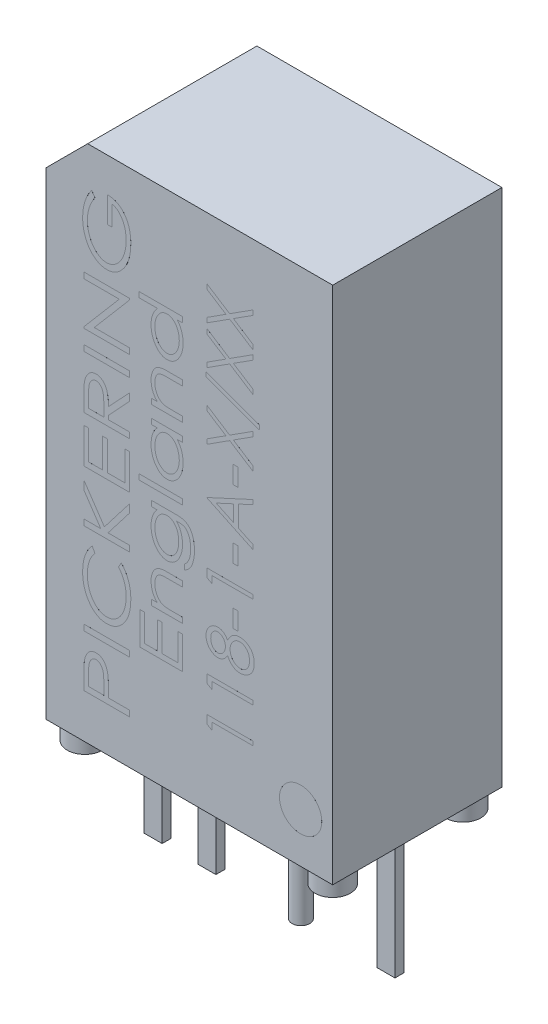
from build123d import *

# Parameters (mm, degrees)
SKETCH1_W           = 8.13
SKETCH1_H           = 4.8
MAIN_BODY_DEPTH     = 14.732
AESTHETIC_CUT_DEPTH = 17.018615702
SKETCH3_R           = 0.5
FEET_DEPTH          = 0.508
SKETCH4_R           = 0.25
SKETCH4_W           = 0.508
SKETCH4_H           = 0.254
PINS_DEPTH          = 3.678
SKETCH5_R           = 0.6
SKETCH5_W           = 1.3
SKETCH5_H           = 0.166666667
SKETCH5_H_2         = 0.166666666
SKETCH5_W_2         = 1.230769231
SKETCH5_H_3         = 0.153846154
SKETCH5_W_3         = 0.133333333
SKETCH5_H_4         = 0.5
LETTERING_DEPTH     = 0.0001


with BuildPart() as part:
    # Sketch1 → Main Body (new body)
    with BuildSketch(Plane(origin=(0, 0, 0), x_dir=(1, 0, 0), z_dir=(0, 1, 0))):
        Rectangle(SKETCH1_W, SKETCH1_H)
    extrude(amount=MAIN_BODY_DEPTH)

    # Sketch2 → Aesthetic cut (cut, through all)
    with BuildSketch(Plane.XY.offset(2.4)):
        Polygon((-2.885, 14.732), (-4.065, 13.552), (-4.065, 14.732), align=None)
    extrude(amount=-AESTHETIC_CUT_DEPTH, mode=Mode.SUBTRACT)

    # Sketch3 → Feet (add)
    with BuildSketch(Plane.XZ):
        with Locations((-3.515, 1.85)):
            Circle(SKETCH3_R)
        with Locations((-3.515, -1.85)):
            Circle(SKETCH3_R)
        with Locations((3.515, 1.85)):
            Circle(SKETCH3_R)
        with Locations((3.515, -1.85)):
            Circle(SKETCH3_R)
    extrude(amount=FEET_DEPTH)

    # Sketch4 → Pins (add)
    with BuildSketch(Plane.XZ):
        with Locations((0.764, 0)):
            Circle(SKETCH4_R)
        with Locations((-3.3, 0)):
            Rectangle(SKETCH4_W, SKETCH4_H)
        with Locations((-1.776, 0)):
            Rectangle(SKETCH4_W, SKETCH4_H)
        with Locations((3.304, 0)):
            Rectangle(SKETCH4_W, SKETCH4_H)
    extrude(amount=PINS_DEPTH)

    # Sketch5 → Lettering (add)
    # profile 1 of 29: a face of its own
    with BuildSketch(Plane.XY.offset(2.4)):
        with Locations((3.155265516, 1.398811684)):
            Circle(SKETCH5_R)
    # profile 2 of 29: a face of its own
    with BuildSketch(Plane.XY.offset(2.4)):
        with BuildLine():
            Line((-2.994356178, 1.244172135), (-2.994356178, 1.594953385))
            add(Edge.make_bspline(
                [(-2.994356178, 1.594953385), (-2.994336953, 1.619085878), (-2.994300161, 1.665270073), (-2.993183793, 1.731418037), (-2.991678405, 1.791492993), (-2.989611027, 1.845403198), (-2.987176632, 1.893261316), (-2.983717683, 1.934837692), (-2.980144014, 1.970422201), (-2.976489347, 1.991929368), (-2.974824928, 2.001724219)],
                knots=[0, 0, 0, 0, 1.420809515, 2.719111778, 3.894993966, 4.958824798, 5.895495181, 6.715916683, 7.415199365, 8, 8, 8, 8], degree=3))
            add(Edge.make_bspline(
                [(-2.974824928, 2.001724219), (-2.972373677, 2.014085309), (-2.967558255, 2.038368367), (-2.957845984, 2.07358681), (-2.946358106, 2.10706727), (-2.933150518, 2.138872894), (-2.917968914, 2.168826287), (-2.90128858, 2.1972363), (-2.882511312, 2.223762), (-2.862026089, 2.248460658), (-2.839974762, 2.270964837), (-2.81629019, 2.29047681), (-2.791276673, 2.307115611), (-2.764868381, 2.320808772), (-2.736900286, 2.331086269), (-2.707722869, 2.338816212), (-2.677129832, 2.343230019), (-2.656262187, 2.343854702), (-2.645658262, 2.344172135)],
                knots=[0, 0, 0, 0, 1.166202924, 2.290976889, 3.378569974, 4.441088525, 5.47602527, 6.484771233, 7.487997516, 8.480807949, 9.452418543, 10.399974389, 11.315931491, 12.228746364, 13.146639915, 14.068499226, 15.018504948, 16, 16, 16, 16], degree=3))
            add(Edge.make_bspline(
                [(-2.645658262, 2.344172135), (-2.634964816, 2.343868076), (-2.614004953, 2.343272099), (-2.583298993, 2.33869765), (-2.554042311, 2.331475798), (-2.526152845, 2.321241352), (-2.499698201, 2.307960436), (-2.474971085, 2.291278032), (-2.451258366, 2.272290502), (-2.429478483, 2.249988478), (-2.409272926, 2.22520422), (-2.390365144, 2.198330328), (-2.373539503, 2.169066712), (-2.35825361, 2.137616194), (-2.345255614, 2.103789392), (-2.33335932, 2.067962026), (-2.323512705, 2.02982613), (-2.318352334, 2.003489302), (-2.315710345, 1.990005469)],
                knots=[0, 0, 0, 0, 0.96744717, 1.896260777, 2.803221632, 3.690541751, 4.579425492, 5.474950013, 6.385340871, 7.324167416, 8.289826681, 9.277102202, 10.294427006, 11.341498734, 12.43856912, 13.571426064, 14.756627529, 16, 16, 16, 16], degree=3))
            add(Edge.make_bspline(
                [(-2.315710345, 1.990005469), (-2.313980757, 1.978818527), (-2.31019602, 1.954338915), (-2.305908642, 1.914198256), (-2.302438673, 1.867552514), (-2.299150525, 1.814345777), (-2.297437354, 1.754504986), (-2.295408735, 1.688107328), (-2.294447797, 1.61509501), (-2.294387607, 1.564224351), (-2.294356178, 1.537661719)],
                knots=[0, 0, 0, 0, 0.599332742, 1.311478438, 2.136747012, 3.076033865, 4.133845615, 5.306369639, 6.593493499, 8, 8, 8, 8], degree=3))
            Line((-2.294356178, 1.537661719), (-2.294356178, 1.410838802))
            Line((-2.294356178, 1.410838802), (-1.694356178, 1.410838802))
            Line((-1.694356178, 1.410838802), (-1.694356178, 1.244172135))
            Line((-1.694356178, 1.244172135), (-2.994356178, 1.244172135))
        make_face()
        with BuildLine():
            Line((-2.861022845, 1.410838802), (-2.427689512, 1.410838802))
            Line((-2.427689512, 1.410838802), (-2.424824928, 1.718651302))
            add(Edge.make_bspline(
                [(-2.424824928, 1.718651302), (-2.424817992, 1.733670259), (-2.424804598, 1.762672901), (-2.426305251, 1.804685836), (-2.427955673, 1.843594425), (-2.430569581, 1.879371679), (-2.433854494, 1.911955984), (-2.438109505, 1.941372775), (-2.442525645, 1.967793667), (-2.450173388, 1.998199725), (-2.46142288, 2.032227151), (-2.478572548, 2.069160074), (-2.500097552, 2.101073726), (-2.524749326, 2.128314289), (-2.552169274, 2.150144456), (-2.581535204, 2.16609113), (-2.612864009, 2.175705709), (-2.634308448, 2.17690158), (-2.645137428, 2.177505469)],
                knots=[0, 0, 0, 0, 1.274619647, 2.461378437, 3.567724242, 4.579773596, 5.505693281, 6.34653861, 7.102393283, 7.777847798, 9.005678947, 10.139359214, 11.222374373, 12.260163291, 13.246269141, 14.182391944, 15.082147049, 16, 16, 16, 16], degree=3))
            add(Edge.make_bspline(
                [(-2.645137428, 2.177505469), (-2.65561459, 2.176875565), (-2.676618142, 2.175612797), (-2.707399922, 2.166158259), (-2.73637178, 2.149985197), (-2.763628782, 2.128342517), (-2.788099051, 2.101635032), (-2.809235426, 2.070680185), (-2.826362847, 2.035766701), (-2.837533671, 2.00356932), (-2.844182011, 1.974751256), (-2.849008729, 1.949684431), (-2.85237195, 1.921294554), (-2.855514279, 1.88978079), (-2.858144884, 1.855053336), (-2.859892675, 1.817104394), (-2.860948625, 1.775862322), (-2.860997464, 1.747297819), (-2.861022845, 1.732453385)],
                knots=[0, 0, 0, 0, 0.913674116, 1.831641411, 2.780932086, 3.794950109, 4.856532686, 5.930345416, 7.055220871, 8.24119917, 8.895386817, 9.635372941, 10.467958592, 11.389171582, 12.399645613, 13.507036225, 14.704453739, 16, 16, 16, 16], degree=3))
            Line((-2.861022845, 1.732453385), (-2.861022845, 1.410838802))
        make_face(mode=Mode.SUBTRACT)
    # profile 3 of 29: a face of its own
    with BuildSketch(Plane.XY.offset(2.4)):
        with Locations((-2.344356178, 2.794172136)):
            Rectangle(SKETCH5_W, SKETCH5_H)
    # profile 4 of 29: a face of its own
    with BuildSketch(Plane.XY.offset(2.4)):
        with BuildLine():
            Line((-2.755814512, 4.910838802), (-2.677689512, 4.771255469))
            add(Edge.make_bspline(
                [(-2.677689512, 4.771255469), (-2.686389044, 4.761536891), (-2.703788688, 4.74209909), (-2.728050393, 4.711229625), (-2.750635764, 4.678914989), (-2.771903004, 4.64532039), (-2.79105446, 4.609939033), (-2.809117231, 4.573382959), (-2.825163885, 4.535224627), (-2.839852086, 4.495921434), (-2.852491797, 4.455265745), (-2.863676832, 4.413563958), (-2.873434184, 4.370959062), (-2.880868131, 4.327197241), (-2.88683188, 4.282547169), (-2.891293704, 4.236953645), (-2.893976718, 4.190385567), (-2.894228589, 4.159019446), (-2.894356178, 4.143130469)],
                knots=[0, 0, 0, 0, 0.920142695, 1.840346541, 2.76810182, 3.701038383, 4.643953804, 5.6054053, 6.576909587, 7.563300981, 8.56478896, 9.579524022, 10.609231574, 11.647374661, 12.71021105, 13.787090289, 14.879017476, 16, 16, 16, 16], degree=3))
            add(Edge.make_bspline(
                [(-2.894356178, 4.143130469), (-2.894209552, 4.125761621), (-2.893918894, 4.091331348), (-2.88996273, 4.040170847), (-2.884429025, 3.990006212), (-2.876305249, 3.94081106), (-2.865766265, 3.892631308), (-2.85354337, 3.845215562), (-2.838125097, 3.799034847), (-2.821222661, 3.753900319), (-2.801926986, 3.710595624), (-2.781195596, 3.669411513), (-2.758779222, 3.630788857), (-2.734825582, 3.594741407), (-2.709183342, 3.561303991), (-2.682160536, 3.530219996), (-2.653358666, 3.501758641), (-2.62325535, 3.475718404), (-2.591853079, 3.452444907), (-2.559039494, 3.432656263), (-2.52543215, 3.415544456), (-2.4906629, 3.401866798), (-2.45522565, 3.390677543), (-2.418639488, 3.383288672), (-2.38120914, 3.378371228), (-2.355830388, 3.37779537), (-2.343054095, 3.377505469)],
                knots=[0, 0, 0, 0, 1.195480647, 2.36980174, 3.530679205, 4.669378189, 5.800524575, 6.925386019, 8.038517949, 9.150670851, 10.242290332, 11.300669871, 12.323631922, 13.314818062, 14.278230263, 15.22271697, 16.148180603, 17.063457898, 17.961123348, 18.835387652, 19.698654999, 20.554276043, 21.404915323, 22.253494788, 23.120765931, 24, 24, 24, 24], degree=3))
            add(Edge.make_bspline(
                [(-2.343054095, 3.377505469), (-2.32381844, 3.378104785), (-2.285922684, 3.379285484), (-2.230456284, 3.390204867), (-2.177325038, 3.407332154), (-2.1268798, 3.43190272), (-2.078609645, 3.462892046), (-2.033290397, 3.501378049), (-1.990178799, 3.546401253), (-1.950186144, 3.597841211), (-1.913643585, 3.654371619), (-1.881552267, 3.715066845), (-1.854753315, 3.779572122), (-1.832542279, 3.84746167), (-1.815411732, 3.918977615), (-1.803348218, 3.994107008), (-1.795494803, 4.072737574), (-1.794740492, 4.126444444), (-1.794356178, 4.153807552)],
                knots=[0, 0, 0, 0, 0.87414655, 1.722137571, 2.561247506, 3.40718598, 4.266972465, 5.16384986, 6.104981705, 7.097869228, 8.123020495, 9.163366839, 10.216426643, 11.29652986, 12.409387586, 13.557727875, 14.755686993, 16, 16, 16, 16], degree=3))
            add(Edge.make_bspline(
                [(-1.794356178, 4.153807552), (-1.794479133, 4.169002854), (-1.794723122, 4.19915599), (-1.797498558, 4.243884464), (-1.801535442, 4.287775548), (-1.807580429, 4.330591403), (-1.815111391, 4.372577058), (-1.824479001, 4.413485985), (-1.835391139, 4.453582037), (-1.848280108, 4.492614632), (-1.862371965, 4.530896033), (-1.878847259, 4.568002592), (-1.896249565, 4.604444035), (-1.916060778, 4.639628838), (-1.936997696, 4.674120373), (-1.960123282, 4.70739087), (-1.984423273, 4.740118743), (-2.002133511, 4.760849859), (-2.011022845, 4.771255469)],
                knots=[0, 0, 0, 0, 1.089663872, 2.162298737, 3.212955089, 4.250133551, 5.262481101, 6.271357723, 7.259133077, 8.241557368, 9.218700461, 10.183348063, 11.152325416, 12.113793538, 13.077978956, 14.045034369, 15.018740269, 16, 16, 16, 16], degree=3))
            Line((-2.011022845, 4.771255469), (-1.933679095, 4.910838802))
            add(Edge.make_bspline(
                [(-1.933679095, 4.910838802), (-1.923061249, 4.899746177), (-1.901751313, 4.877483363), (-1.871751984, 4.842053567), (-1.843874668, 4.804394869), (-1.817785263, 4.764753207), (-1.793632124, 4.72305667), (-1.771148967, 4.67945354), (-1.750595828, 4.633801519), (-1.731891671, 4.586269332), (-1.715256868, 4.536980382), (-1.700570669, 4.486184636), (-1.688558193, 4.433887176), (-1.678079144, 4.380270343), (-1.670922775, 4.325174426), (-1.664973882, 4.268757009), (-1.661561523, 4.210881449), (-1.661203901, 4.171780538), (-1.661022845, 4.151984635)],
                knots=[0, 0, 0, 0, 0.890761899, 1.787752334, 2.69127933, 3.607615044, 4.539663142, 5.485703007, 6.452705038, 7.443122545, 8.44808224, 9.469862093, 10.509471364, 11.560436988, 12.638082652, 13.731558427, 14.851539537, 16, 16, 16, 16], degree=3))
            add(Edge.make_bspline(
                [(-1.661022845, 4.151984635), (-1.661120806, 4.133230037), (-1.661314582, 4.096131865), (-1.664421723, 4.04134117), (-1.668685039, 3.98799256), (-1.67505111, 3.936248162), (-1.682671295, 3.885802333), (-1.692675826, 3.837026396), (-1.704095066, 3.789647761), (-1.717346682, 3.743839411), (-1.732456504, 3.699516426), (-1.749350931, 3.656730743), (-1.768255293, 3.615555946), (-1.788367368, 3.57567778), (-1.810688649, 3.537510483), (-1.834700007, 3.500770792), (-1.860258148, 3.465266215), (-1.879020493, 3.443016046), (-1.888366595, 3.431932552)],
                knots=[0, 0, 0, 0, 1.166509796, 2.307454447, 3.412870271, 4.49525463, 5.549967715, 6.585696017, 7.591558751, 8.58105397, 9.551009581, 10.503629212, 11.441238732, 12.368606997, 13.280885304, 14.190025764, 15.098396119, 16, 16, 16, 16], degree=3))
            add(Edge.make_bspline(
                [(-1.888366595, 3.431932552), (-1.904418438, 3.414302487), (-1.935854304, 3.379775835), (-1.98815921, 3.334953338), (-2.04249325, 3.296599186), (-2.099384614, 3.264943037), (-2.159045142, 3.240634541), (-2.22120032, 3.223514764), (-2.285727038, 3.212631289), (-2.329642302, 3.211441865), (-2.351908262, 3.210838802)],
                knots=[0, 0, 0, 0, 1.077646829, 2.110459378, 3.108307753, 4.081983267, 5.048857668, 6.014870583, 6.993497765, 8, 8, 8, 8], degree=3))
            add(Edge.make_bspline(
                [(-2.351908262, 3.210838802), (-2.363720789, 3.211035228), (-2.387127186, 3.211424444), (-2.421830686, 3.214646322), (-2.455837994, 3.219847196), (-2.489151142, 3.227147883), (-2.521840386, 3.236443366), (-2.553567421, 3.248325069), (-2.584744571, 3.261867842), (-2.615190676, 3.27751459), (-2.645034862, 3.295206019), (-2.673842423, 3.31546393), (-2.702323423, 3.337264274), (-2.730036269, 3.361295387), (-2.756706563, 3.387657023), (-2.782951267, 3.415909123), (-2.808304871, 3.446330688), (-2.841436824, 3.489519822), (-2.879680619, 3.547061794), (-2.919281491, 3.620701098), (-2.952690077, 3.698585271), (-2.980366625, 3.780485954), (-3.001733018, 3.866813373), (-3.016564984, 3.957300662), (-3.025946751, 4.051960776), (-3.027100566, 4.116458605), (-3.027689512, 4.149380469)],
                knots=[0, 0, 0, 0, 0.662661864, 1.31305734, 1.953659441, 2.591812947, 3.225359189, 3.858680744, 4.491177758, 5.131576167, 5.778075765, 6.436031598, 7.106257019, 7.789851299, 8.492440301, 9.209300768, 9.952624537, 10.713422111, 12.262801267, 13.823065812, 15.398196587, 17.012294043, 18.66840451, 20.381881456, 22.153190509, 24, 24, 24, 24], degree=3))
            add(Edge.make_bspline(
                [(-3.027689512, 4.149380469), (-3.027509665, 4.169437132), (-3.027153601, 4.209145823), (-3.023710923, 4.267882336), (-3.017939116, 4.32512059), (-3.010122555, 4.380892076), (-3.000372216, 4.435244179), (-2.988062776, 4.488074956), (-2.973462584, 4.539320308), (-2.956870877, 4.589062796), (-2.938104598, 4.636918546), (-2.917621614, 4.682778145), (-2.89513026, 4.72638418), (-2.87099506, 4.767841257), (-2.844886094, 4.806895702), (-2.817212433, 4.843879076), (-2.787551888, 4.878518296), (-2.76635523, 4.900104413), (-2.755814512, 4.910838802)],
                knots=[0, 0, 0, 0, 1.159761406, 2.296125024, 3.401007415, 4.485761794, 5.552112792, 6.593210377, 7.621301647, 8.632488791, 9.624339884, 10.592756546, 11.535702135, 12.460365181, 13.365333243, 14.250837049, 15.130172608, 16, 16, 16, 16], degree=3))
        make_face()
    # profile 5 of 29: a face of its own
    with BuildSketch(Plane.XY.offset(2.4)):
        Polygon((-2.994356178, 5.294172135), (-2.994356178, 5.460838802), (-2.512585345, 5.460838802), (-2.994356178, 6.173859635), (-2.994356178, 6.419172135), (-2.411022845, 5.555890885), (-1.694356178, 6.485838802), (-1.694356178, 6.255890885), (-2.307377012, 5.460838802), (-1.694356178, 5.460838802), (-1.694356178, 5.294172135), align=None)
    # profile 6 of 29: a face of its own
    with BuildSketch(Plane.XY.offset(2.4)):
        Polygon((-2.994356178, 6.760838802), (-2.994356178, 7.760838802), (-2.861022845, 7.760838802), (-2.861022845, 6.927505469), (-2.461022845, 6.927505469), (-2.461022845, 7.760838802), (-2.327689512, 7.760838802), (-2.327689512, 6.927505469), (-1.827689512, 6.927505469), (-1.827689512, 7.760838802), (-1.694356178, 7.760838802), (-1.694356178, 6.760838802), align=None)
    # profile 7 of 29: a face of its own
    with BuildSketch(Plane.XY.offset(2.4)):
        with BuildLine():
            Line((-2.994356178, 8.077505469), (-2.994356178, 8.433234635))
            add(Edge.make_bspline(
                [(-2.994356178, 8.433234635), (-2.994299151, 8.457019281), (-2.994189879, 8.502593462), (-2.993562665, 8.567967174), (-2.991801208, 8.627335254), (-2.990267523, 8.680743657), (-2.987492914, 8.728042487), (-2.984838322, 8.769396738), (-2.981322991, 8.804761012), (-2.978109764, 8.826299754), (-2.976647845, 8.836099219)],
                knots=[0, 0, 0, 0, 1.414457622, 2.710267318, 3.887660886, 4.946532696, 5.887473808, 6.705078807, 7.41085072, 8, 8, 8, 8], degree=3))
            add(Edge.make_bspline(
                [(-2.976647845, 8.836099219), (-2.974305162, 8.849070548), (-2.969697803, 8.874581274), (-2.959908158, 8.911586642), (-2.948472699, 8.946812703), (-2.935332179, 8.980256729), (-2.919737125, 9.011627668), (-2.902715243, 9.041340363), (-2.883550227, 9.06905129), (-2.862814243, 9.094873237), (-2.840425062, 9.118180805), (-2.81645249, 9.13842148), (-2.791370078, 9.155838836), (-2.764856505, 9.169856462), (-2.737042242, 9.180677953), (-2.708071664, 9.188488219), (-2.677762683, 9.193296577), (-2.657134124, 9.193878029), (-2.646699928, 9.194172135)],
                knots=[0, 0, 0, 0, 1.18980835, 2.339997315, 3.452940414, 4.532936613, 5.581061005, 6.613564893, 7.622382484, 8.620054607, 9.601209483, 10.535568896, 11.448712017, 12.353337961, 13.236868066, 14.138125954, 15.058239734, 16, 16, 16, 16], degree=3))
            add(Edge.make_bspline(
                [(-2.646699928, 9.194172135), (-2.637920376, 9.194001223), (-2.620554157, 9.193663152), (-2.594949945, 9.190084032), (-2.570187842, 9.184697964), (-2.546198897, 9.177057762), (-2.523091157, 9.167200091), (-2.500797034, 9.155003095), (-2.479104597, 9.141056825), (-2.458535868, 9.124538304), (-2.439139957, 9.10598059), (-2.420418691, 9.085935989), (-2.403333171, 9.063691148), (-2.387298515, 9.039646652), (-2.372935854, 9.013534304), (-2.359179252, 8.985846078), (-2.347070751, 8.956121958), (-2.336025205, 8.924419943), (-2.326389546, 8.890141086), (-2.317754725, 8.853070123), (-2.310937537, 8.812767848), (-2.304873987, 8.769535604), (-2.300283631, 8.723227656), (-2.296922225, 8.673812926), (-2.294835229, 8.621360023), (-2.294518623, 8.585319916), (-2.294356178, 8.566828385)],
                knots=[0, 0, 0, 0, 0.78617449, 1.555076862, 2.311806077, 3.054658057, 3.807339384, 4.559055632, 5.329215794, 6.115120921, 6.918384435, 7.733014745, 8.570024042, 9.42858279, 10.320016024, 11.238324595, 12.197394942, 13.193592261, 14.244863151, 15.386321155, 16.602373506, 17.905823773, 19.297334377, 20.770813478, 22.343162458, 24, 24, 24, 24], degree=3))
            Line((-2.294356178, 8.566828385), (-1.694356178, 9.210838802))
            Line((-1.694356178, 9.210838802), (-1.694356178, 8.999380469))
            Line((-1.694356178, 8.999380469), (-2.294356178, 8.355370052))
            Line((-2.294356178, 8.355370052), (-2.294356178, 8.244172135))
            Line((-2.294356178, 8.244172135), (-1.694356178, 8.244172135))
            Line((-1.694356178, 8.244172135), (-1.694356178, 8.077505469))
            Line((-1.694356178, 8.077505469), (-2.994356178, 8.077505469))
        make_face()
        with BuildLine():
            Line((-2.861022845, 8.244172135), (-2.427689512, 8.244172135))
            Line((-2.427689512, 8.244172135), (-2.425866595, 8.563703385))
            add(Edge.make_bspline(
                [(-2.425866595, 8.563703385), (-2.425860437, 8.57872229), (-2.425848546, 8.60772483), (-2.427335683, 8.649651804), (-2.429020626, 8.688557908), (-2.431597641, 8.724425558), (-2.434949291, 8.75734627), (-2.439053916, 8.787237301), (-2.44390182, 8.814117246), (-2.451474662, 8.845228971), (-2.462519806, 8.880220366), (-2.480508821, 8.917536506), (-2.501486498, 8.950446978), (-2.526614711, 8.977650848), (-2.55388277, 8.999944907), (-2.583421336, 9.015737218), (-2.614633698, 9.025788667), (-2.636121981, 9.026929865), (-2.646960345, 9.027505469)],
                knots=[0, 0, 0, 0, 1.264217318, 2.441290822, 3.531308106, 4.542386243, 5.468017982, 6.316474189, 7.081844639, 7.765983621, 9.011541372, 10.162047989, 11.244371255, 12.284014556, 13.266620981, 14.19510397, 15.089637761, 16, 16, 16, 16], degree=3))
            add(Edge.make_bspline(
                [(-2.646960345, 9.027505469), (-2.657445194, 9.026905127), (-2.678406598, 9.02570492), (-2.708986431, 9.015849712), (-2.737759395, 8.999445983), (-2.764692484, 8.977327484), (-2.788612561, 8.949946344), (-2.809606531, 8.918528314), (-2.826240141, 8.88287372), (-2.837533948, 8.850269254), (-2.844237939, 8.820939875), (-2.848968274, 8.795334518), (-2.85239158, 8.766261768), (-2.85553309, 8.733878214), (-2.858128349, 8.698106966), (-2.859905033, 8.658857894), (-2.860943099, 8.616313341), (-2.860995647, 8.586794272), (-2.861022845, 8.571515885)],
                knots=[0, 0, 0, 0, 0.899328837, 1.797946289, 2.72941168, 3.731040679, 4.77701957, 5.842174931, 6.966237037, 8.147705404, 8.798878592, 9.549246242, 10.383554827, 11.312569225, 12.344363061, 13.464162459, 14.687509211, 16, 16, 16, 16], degree=3))
            Line((-2.861022845, 8.571515885), (-2.861022845, 8.244172135))
        make_face(mode=Mode.SUBTRACT)
    # profile 8 of 29: a face of its own
    with BuildSketch(Plane.XY.offset(2.4)):
        with Locations((-2.344356178, 9.660838802)):
            Rectangle(SKETCH5_W, SKETCH5_H_2)
    # profile 9 of 29: a face of its own
    with BuildSketch(Plane.XY.offset(2.4)):
        Polygon((-1.694356178, 10.144172135), (-2.994356178, 10.144172135), (-2.994356178, 10.179328385), (-1.988887428, 11.360838802), (-2.994356178, 11.360838802), (-2.994356178, 11.527505469), (-1.694356178, 11.527505469), (-1.694356178, 11.489484635), (-2.697220762, 10.310838802), (-1.694356178, 10.310838802), align=None)
    # profile 10 of 29: a face of its own
    with BuildSketch(Plane.XY.offset(2.4)):
        with BuildLine():
            Line((-2.772481178, 13.644172135), (-2.677689512, 13.506932552))
            add(Edge.make_bspline(
                [(-2.677689512, 13.506932552), (-2.694772697, 13.482460744), (-2.728862151, 13.433627312), (-2.772547258, 13.355552887), (-2.809920091, 13.274130093), (-2.840352087, 13.189901061), (-2.864196465, 13.10463369), (-2.88138691, 13.019872342), (-2.892433363, 12.936130952), (-2.893718739, 12.880576645), (-2.894356178, 12.853026302)],
                knots=[0, 0, 0, 0, 1.022849111, 2.041092833, 3.062659212, 4.091811925, 5.108649488, 6.095759784, 7.055654319, 8, 8, 8, 8], degree=3))
            add(Edge.make_bspline(
                [(-2.894356178, 12.853026302), (-2.894208229, 12.836091305), (-2.893914249, 12.802441097), (-2.889949939, 12.752323366), (-2.884403756, 12.702853542), (-2.876218418, 12.653938275), (-2.865881755, 12.605598582), (-2.853042255, 12.557814881), (-2.837995047, 12.510683293), (-2.820538722, 12.464600558), (-2.8015474, 12.41996408), (-2.780368849, 12.377776104), (-2.757776102, 12.338012496), (-2.733249675, 12.301005748), (-2.707102008, 12.266521894), (-2.679619853, 12.234429557), (-2.650295926, 12.205071077), (-2.619377242, 12.178646685), (-2.58744779, 12.154958822), (-2.554868612, 12.134371259), (-2.521869127, 12.116696107), (-2.488406601, 12.102395126), (-2.454384289, 12.091378987), (-2.420105917, 12.083221436), (-2.385204896, 12.078412934), (-2.361818511, 12.077808646), (-2.350085345, 12.077505469)],
                knots=[0, 0, 0, 0, 1.167431938, 2.319712712, 3.464569602, 4.599147232, 5.737916918, 6.871862824, 8.009515089, 9.147922914, 10.268680182, 11.35279587, 12.401091403, 13.420397465, 14.411619638, 15.383514969, 16.331581092, 17.269713183, 18.185525152, 19.070620952, 19.924797838, 20.764187518, 21.576220219, 22.387811598, 23.191150193, 24, 24, 24, 24], degree=3))
            add(Edge.make_bspline(
                [(-2.350085345, 12.077505469), (-2.338084733, 12.077757961), (-2.314055552, 12.078263535), (-2.27836007, 12.083869352), (-2.242960187, 12.091993152), (-2.208293007, 12.104231597), (-2.173960348, 12.119409916), (-2.139978843, 12.137908957), (-2.106756261, 12.160252617), (-2.073895576, 12.185398309), (-2.042414193, 12.213797685), (-2.011920821, 12.244414598), (-1.983982584, 12.278289716), (-1.957204771, 12.314335704), (-1.932288791, 12.353030273), (-1.90938159, 12.394456817), (-1.88797338, 12.43821654), (-1.868571747, 12.484410051), (-1.851245356, 12.532517633), (-1.835773365, 12.581890745), (-1.823075173, 12.632525337), (-1.81272429, 12.684253861), (-1.804216666, 12.73704214), (-1.798758873, 12.791047975), (-1.794785066, 12.84610925), (-1.794500157, 12.883227153), (-1.794356178, 12.901984635)],
                knots=[0, 0, 0, 0, 0.788153219, 1.578142497, 2.369778531, 3.172766228, 3.990219716, 4.835400622, 5.712119311, 6.619423565, 7.552903725, 8.497047622, 9.457007425, 10.436157745, 11.447513207, 12.479438988, 13.546115254, 14.648233703, 15.770912424, 16.906092734, 18.047793341, 19.200378008, 20.372971379, 21.560737262, 22.767321918, 24, 24, 24, 24], degree=3))
            add(Edge.make_bspline(
                [(-1.794356178, 12.901984635), (-1.794707843, 12.924564956), (-1.795397256, 12.968832062), (-1.800760712, 13.033860295), (-1.809163552, 13.09625398), (-1.821489925, 13.155987568), (-1.837002211, 13.213216582), (-1.856294993, 13.267688695), (-1.879027158, 13.31946971), (-1.904895323, 13.368270264), (-1.933596111, 13.413251219), (-1.964267396, 13.454072205), (-1.997565234, 13.489528162), (-2.032510002, 13.520707971), (-2.069927271, 13.546555693), (-2.109411598, 13.567596948), (-2.150880537, 13.584061492), (-2.179841207, 13.590796551), (-2.194356178, 13.594172135)],
                knots=[0, 0, 0, 0, 1.255424497, 2.46117009, 3.625721614, 4.754100604, 5.850125891, 6.920295451, 7.964192143, 8.992018671, 9.988225273, 10.928511503, 11.826673757, 12.688498711, 13.528002378, 14.34855952, 15.172304679, 16, 16, 16, 16], degree=3))
            Line((-2.194356178, 13.594172135), (-2.194356178, 13.027505469))
            Line((-2.194356178, 13.027505469), (-2.327689512, 13.027505469))
            Line((-2.327689512, 13.027505469), (-2.327689512, 13.760838802))
            add(Edge.make_bspline(
                [(-2.327689512, 13.760838802), (-2.315098646, 13.760509085), (-2.290234341, 13.759857963), (-2.253351749, 13.757076563), (-2.217463534, 13.752064324), (-2.182497279, 13.745354489), (-2.148644365, 13.736648197), (-2.115660923, 13.726655806), (-2.083828611, 13.714236862), (-2.052829431, 13.700248459), (-2.02283235, 13.684313875), (-1.993857145, 13.666590558), (-1.96593703, 13.646915728), (-1.938835686, 13.625700942), (-1.91299765, 13.602296194), (-1.887982324, 13.57725323), (-1.86372705, 13.550540322), (-1.833092686, 13.512015704), (-1.797856108, 13.46034951), (-1.76086034, 13.393571943), (-1.729917045, 13.321643475), (-1.704695853, 13.244647832), (-1.684970064, 13.162785601), (-1.671023004, 13.075902839), (-1.662639559, 12.984094825), (-1.66157046, 12.92118669), (-1.661022845, 12.888963802)],
                knots=[0, 0, 0, 0, 0.735625378, 1.452704974, 2.159002162, 2.851088683, 3.531128223, 4.199884444, 4.862771898, 5.52534903, 6.18537991, 6.845391315, 7.507910245, 8.179409366, 8.854383327, 9.542745322, 10.246362194, 10.960603993, 12.416158641, 13.893564592, 15.412834604, 16.98253, 18.620563035, 20.326012051, 22.118105066, 24, 24, 24, 24], degree=3))
            add(Edge.make_bspline(
                [(-1.661022845, 12.888963802), (-1.661234562, 12.869168386), (-1.661652644, 12.830077808), (-1.66462023, 12.77223655), (-1.669158363, 12.715928305), (-1.676032831, 12.661222611), (-1.68449427, 12.608018111), (-1.69524478, 12.556437582), (-1.707732266, 12.506392383), (-1.72197744, 12.457848638), (-1.738451036, 12.410965727), (-1.756684911, 12.365602963), (-1.776682004, 12.321715918), (-1.798927393, 12.27956385), (-1.822742262, 12.238805194), (-1.849057212, 12.199993181), (-1.876736036, 12.162362252), (-1.89682369, 12.13859462), (-1.906856178, 12.126724219)],
                knots=[0, 0, 0, 0, 1.160356497, 2.291389345, 3.394315085, 4.471058968, 5.522607035, 6.551503718, 7.558563992, 8.545536224, 9.515946632, 10.470308312, 11.410690068, 12.34160744, 13.263173959, 14.17628679, 15.08917274, 16, 16, 16, 16], degree=3))
            add(Edge.make_bspline(
                [(-1.906856178, 12.126724219), (-1.922605167, 12.109574861), (-1.953425499, 12.076014045), (-2.003830391, 12.03201958), (-2.056032253, 11.994615082), (-2.11003658, 11.963849258), (-2.166241392, 11.940314431), (-2.224110025, 11.923269201), (-2.283903712, 11.91274248), (-2.32443539, 11.91147702), (-2.344877012, 11.910838802)],
                knots=[0, 0, 0, 0, 1.107702559, 2.167743102, 3.177925956, 4.160458064, 5.119758845, 6.071644335, 7.027459056, 8, 8, 8, 8], degree=3))
            add(Edge.make_bspline(
                [(-2.344877012, 11.910838802), (-2.360178777, 11.911128173), (-2.390641839, 11.911704258), (-2.435774295, 11.918225334), (-2.480261221, 11.927207247), (-2.523658503, 11.941194231), (-2.566557239, 11.958103691), (-2.608178255, 11.979958893), (-2.649623849, 12.00443512), (-2.689380388, 12.033601618), (-2.728272182, 12.065298198), (-2.764573461, 12.100724518), (-2.799274685, 12.138450719), (-2.831082, 12.179622823), (-2.861519572, 12.223035522), (-2.889297574, 12.269624016), (-2.915172923, 12.318854668), (-2.938442777, 12.370941042), (-2.959565148, 12.425205782), (-2.977749974, 12.481483058), (-2.993098833, 12.539574407), (-3.005953644, 12.599326875), (-3.015419168, 12.660921849), (-3.022429108, 12.724168586), (-3.027096125, 12.78915408), (-3.027490297, 12.833139715), (-3.027689512, 12.855370052)],
                knots=[0, 0, 0, 0, 0.852087438, 1.696352775, 2.53697908, 3.378495761, 4.233694743, 5.103437492, 5.995299083, 6.91363714, 7.8483049, 8.789149152, 9.737722225, 10.702549871, 11.686197989, 12.69089035, 13.723031124, 14.78399551, 15.868326143, 16.966744734, 18.077967778, 19.215581337, 20.371196358, 21.54915483, 22.761343026, 24, 24, 24, 24], degree=3))
            add(Edge.make_bspline(
                [(-3.027689512, 12.855370052), (-3.027470987, 12.873429229), (-3.027035772, 12.909396106), (-3.024106498, 12.96290328), (-3.019415528, 13.015624171), (-3.012995812, 13.067511421), (-3.004320585, 13.118567862), (-2.993908353, 13.168863895), (-2.98172588, 13.218423257), (-2.967343882, 13.267242099), (-2.950848344, 13.315517798), (-2.932465583, 13.363475437), (-2.911433246, 13.411011169), (-2.888386035, 13.458348194), (-2.862673869, 13.505346807), (-2.834879862, 13.552077102), (-2.804932055, 13.598628952), (-2.783368599, 13.628892185), (-2.772481178, 13.644172135)],
                knots=[0, 0, 0, 0, 1.027146459, 2.045677455, 3.04696207, 4.037205961, 5.018535294, 5.99168279, 6.958043257, 7.920422521, 8.885331436, 9.859079934, 10.840645225, 11.840918988, 12.852810778, 13.886687112, 14.932985219, 16, 16, 16, 16], degree=3))
        make_face()
    # profile 11 of 29: a face of its own
    with BuildSketch(Plane.XY.offset(2.4)):
        Polygon((-1.394356178, 3.106992648), (-1.394356178, 4.030069571), (-1.271279255, 4.030069571), (-1.271279255, 3.260838802), (-0.902048486, 3.260838802), (-0.902048486, 4.030069571), (-0.778971563, 4.030069571), (-0.778971563, 3.260838802), (-0.317433102, 3.260838802), (-0.317433102, 4.030069571), (-0.194356178, 4.030069571), (-0.194356178, 3.106992648), align=None)
    # profile 12 of 29: a face of its own
    with BuildSketch(Plane.XY.offset(2.4)):
        with BuildLine():
            Line((-1.071279255, 4.291608033), (-1.071279255, 4.445454187))
            Line((-1.071279255, 4.445454187), (-0.913106178, 4.445454187))
            add(Edge.make_bspline(
                [(-0.913106178, 4.445454187), (-0.927564378, 4.461022147), (-0.956018503, 4.491660313), (-0.99206346, 4.542187637), (-1.022523505, 4.594780378), (-1.046329342, 4.650224495), (-1.064329508, 4.708136435), (-1.077312931, 4.76837995), (-1.085136568, 4.831145611), (-1.086149528, 4.873797273), (-1.086663871, 4.895454187)],
                knots=[0, 0, 0, 0, 1.028506368, 2.024128206, 2.999754602, 3.968349268, 4.940857588, 5.933841691, 6.950882355, 8, 8, 8, 8], degree=3))
            add(Edge.make_bspline(
                [(-1.086663871, 4.895454187), (-1.086553716, 4.906517265), (-1.086336328, 4.928350079), (-1.083761183, 4.960587605), (-1.080089348, 4.991915082), (-1.074359061, 5.022178606), (-1.067843246, 5.051739894), (-1.059104403, 5.080183045), (-1.048983885, 5.107704554), (-1.03750664, 5.134157526), (-1.024527493, 5.159209855), (-1.010734737, 5.182902547), (-0.995364931, 5.204562437), (-0.979436851, 5.224816818), (-0.962134123, 5.243202213), (-0.943989327, 5.260133743), (-0.924373996, 5.274975845), (-0.903612624, 5.288548302), (-0.880804216, 5.300424306), (-0.855282885, 5.310570931), (-0.826822476, 5.318813574), (-0.795500801, 5.325731318), (-0.761318741, 5.331274346), (-0.724148126, 5.334950024), (-0.68413415, 5.337451763), (-0.656459727, 5.337656388), (-0.642192717, 5.337761879)],
                knots=[0, 0, 0, 0, 1.103642835, 2.178022148, 3.225283033, 4.249365621, 5.250180252, 6.244233086, 7.215615067, 8.175211049, 9.119258509, 10.029765669, 10.908145809, 11.767246035, 12.598818842, 13.42495408, 14.240536595, 15.05002158, 15.897584707, 16.801786072, 17.7858852, 18.850851616, 20.0010125, 21.238950798, 22.576594827, 24, 24, 24, 24], degree=3))
            Line((-0.642192717, 5.337761879), (-0.194356178, 5.337761879))
            Line((-0.194356178, 5.337761879), (-0.194356178, 5.183915725))
            Line((-0.194356178, 5.183915725), (-0.606856178, 5.183915725))
            add(Edge.make_bspline(
                [(-0.606856178, 5.183915725), (-0.618795395, 5.183850739), (-0.641633084, 5.183726432), (-0.674329836, 5.183310472), (-0.703906324, 5.182403036), (-0.730423944, 5.180882451), (-0.753846758, 5.179352387), (-0.774213026, 5.177183155), (-0.791394983, 5.174678141), (-0.801737131, 5.172425843), (-0.806375409, 5.171415725)],
                knots=[0, 0, 0, 0, 1.430934443, 2.737134061, 3.918973087, 4.976914145, 5.92044225, 6.731742364, 7.431207999, 8, 8, 8, 8], degree=3))
            add(Edge.make_bspline(
                [(-0.806375409, 5.171415725), (-0.813387385, 5.169629108), (-0.827137834, 5.166125561), (-0.846760294, 5.158622328), (-0.864977271, 5.149166767), (-0.881814323, 5.137763621), (-0.897598005, 5.12479878), (-0.911772157, 5.10977895), (-0.92461209, 5.092999041), (-0.936159317, 5.074499511), (-0.946076513, 5.054256539), (-0.955152557, 5.03274238), (-0.962522721, 5.009634828), (-0.968450164, 4.985027051), (-0.973334857, 4.958966278), (-0.976606133, 4.931421683), (-0.978525674, 4.902372716), (-0.978820246, 4.882556548), (-0.978971563, 4.872377263)],
                knots=[0, 0, 0, 0, 0.923951236, 1.811863738, 2.677299849, 3.540492559, 4.405625847, 5.281834063, 6.17257507, 7.101504162, 8.062978725, 9.049738332, 10.082531589, 11.157687817, 12.282161177, 13.468191915, 14.699446081, 16, 16, 16, 16], degree=3))
            add(Edge.make_bspline(
                [(-0.978971563, 4.872377263), (-0.978805665, 4.860671709), (-0.978476668, 4.837458165), (-0.975284648, 4.803164526), (-0.969997857, 4.76975628), (-0.962516059, 4.737333143), (-0.953119199, 4.705784333), (-0.941861041, 4.675008343), (-0.928104017, 4.645365639), (-0.91261996, 4.61679056), (-0.895271572, 4.590189227), (-0.877490418, 4.56518724), (-0.858000437, 4.543075009), (-0.837981355, 4.52296319), (-0.816565963, 4.505638726), (-0.794497052, 4.490255027), (-0.771062158, 4.477789039), (-0.75483093, 4.471124078), (-0.746760025, 4.467809956)],
                knots=[0, 0, 0, 0, 1.136197442, 2.253218311, 3.34031182, 4.417843977, 5.481129016, 6.534579201, 7.596240926, 8.651068921, 9.686849803, 10.678025832, 11.62645711, 12.545101186, 13.429613109, 14.297026228, 15.153203861, 16, 16, 16, 16], degree=3))
            add(Edge.make_bspline(
                [(-0.746760025, 4.467809956), (-0.740856136, 4.465951237), (-0.728067446, 4.461924977), (-0.706877845, 4.457612081), (-0.682419907, 4.45373954), (-0.654656675, 4.45073944), (-0.623552762, 4.448333221), (-0.589158264, 4.446802092), (-0.551418044, 4.445432147), (-0.525126924, 4.445446635), (-0.511423486, 4.445454187)],
                knots=[0, 0, 0, 0, 0.625834748, 1.355650197, 2.184622647, 3.130870263, 4.179753733, 5.340379712, 6.613754723, 8, 8, 8, 8], degree=3))
            Line((-0.511423486, 4.445454187), (-0.194356178, 4.445454187))
            Line((-0.194356178, 4.445454187), (-0.194356178, 4.291608033))
            Line((-0.194356178, 4.291608033), (-1.071279255, 4.291608033))
        make_face()
    # profile 13 of 29: a face of its own
    with BuildSketch(Plane.XY.offset(2.4)):
        with BuildLine():
            Line((-1.071279255, 6.722377263), (-1.071279255, 6.876223417))
            Line((-1.071279255, 6.876223417), (-0.375365794, 6.876223417))
            add(Edge.make_bspline(
                [(-0.375365794, 6.876223417), (-0.36053864, 6.876102507), (-0.331909197, 6.875869044), (-0.290544391, 6.873597938), (-0.25226895, 6.870400405), (-0.217045193, 6.865596511), (-0.184895708, 6.859506264), (-0.155826821, 6.851770785), (-0.129776939, 6.842856371), (-0.113929341, 6.83533663), (-0.106375409, 6.831752263)],
                knots=[0, 0, 0, 0, 1.294216437, 2.498975674, 3.615458974, 4.646243772, 5.601033693, 6.469747245, 7.270588254, 8, 8, 8, 8], degree=3))
            add(Edge.make_bspline(
                [(-0.106375409, 6.831752263), (-0.096479427, 6.826340193), (-0.0767444, 6.815547192), (-0.049196622, 6.795762725), (-0.023347754, 6.773326409), (0.000676037, 6.747952831), (0.023145423, 6.719920679), (0.043859539, 6.689071465), (0.062589969, 6.65522547), (0.07946892, 6.618751406), (0.094905982, 6.580133429), (0.108150101, 6.539340903), (0.119061432, 6.496582986), (0.12820795, 6.45198221), (0.135471011, 6.405546321), (0.140356835, 6.357155149), (0.143649709, 6.306878192), (0.143951675, 6.272703269), (0.14410536, 6.255309956)],
                knots=[0, 0, 0, 0, 0.819634705, 1.634553634, 2.460667113, 3.305617657, 4.171997914, 5.070603705, 6.004491325, 6.98209745, 7.991691844, 9.027336105, 10.098662087, 11.199209493, 12.337373551, 13.515025047, 14.735272996, 16, 16, 16, 16], degree=3))
            add(Edge.make_bspline(
                [(0.14410536, 6.255309956), (0.143775857, 6.229976625), (0.14313359, 6.180596895), (0.136993548, 6.108502196), (0.127092014, 6.040371759), (0.112917199, 5.97654912), (0.095506645, 5.917607749), (0.07542221, 5.864014246), (0.052685439, 5.816073632), (0.026502347, 5.773084397), (-0.004600639, 5.734042858), (-0.041344623, 5.697307478), (-0.084316664, 5.66210547), (-0.116267149, 5.641001547), (-0.132817717, 5.630069571)],
                knots=[0, 0, 0, 0, 1.269775069, 2.475045661, 3.624304583, 4.718792042, 5.749562549, 6.703036878, 7.585211808, 8.405749916, 9.220683918, 10.081341856, 11.006122046, 12, 12, 12, 12], degree=3))
            Line((-0.132817717, 5.630069571), (-0.132817717, 5.783915725))
            add(Edge.make_bspline(
                [(-0.132817717, 5.783915725), (-0.125761208, 5.789910753), (-0.111707397, 5.801850508), (-0.092159885, 5.821441047), (-0.074221645, 5.842355763), (-0.057499074, 5.864411066), (-0.041999459, 5.887644252), (-0.028527802, 5.912530048), (-0.015789444, 5.938310408), (-0.00484701, 5.965616613), (0.005115199, 5.994286324), (0.013515704, 6.024642463), (0.020315648, 6.056720022), (0.026460377, 6.090351471), (0.030970618, 6.125739419), (0.033987135, 6.162720081), (0.035978102, 6.201362179), (0.036265782, 6.227663177), (0.036413052, 6.241127263)],
                knots=[0, 0, 0, 0, 0.880151359, 1.752917906, 2.628075599, 3.498177611, 4.383589541, 5.280498482, 6.186903556, 7.116452998, 8.075418711, 9.071761606, 10.108897786, 11.192431278, 12.321741095, 13.499240504, 14.719803637, 16, 16, 16, 16], degree=3))
            add(Edge.make_bspline(
                [(0.036413052, 6.241127263), (0.036263437, 6.254350926), (0.035969487, 6.280331401), (0.033987418, 6.318573161), (0.030971436, 6.355313887), (0.026459625, 6.390461438), (0.020321323, 6.423854039), (0.013483399, 6.455762052), (0.005091482, 6.48611699), (-0.004831481, 6.514737741), (-0.015283929, 6.541781404), (-0.026834721, 6.566673348), (-0.038901545, 6.589598033), (-0.051317872, 6.610724016), (-0.064775359, 6.629609559), (-0.078764307, 6.646633681), (-0.093480361, 6.661601167), (-0.109101341, 6.674931159), (-0.12645543, 6.686457016), (-0.146222872, 6.696055478), (-0.168398611, 6.704138871), (-0.193160928, 6.710894352), (-0.220501556, 6.716029548), (-0.250430284, 6.719912055), (-0.28286836, 6.721976829), (-0.305331085, 6.722240732), (-0.316952332, 6.722377263)],
                knots=[0, 0, 0, 0, 1.383965926, 2.719072176, 4.006797281, 5.241519518, 6.425917309, 7.559307681, 8.655988972, 9.719461333, 10.728607237, 11.689194002, 12.58950001, 13.439498834, 14.251584115, 15.013952425, 15.743366514, 16.445614714, 17.159681256, 17.917283705, 18.739824065, 19.626869592, 20.600545954, 21.649066523, 22.783728261, 24, 24, 24, 24], degree=3))
            Line((-0.316952332, 6.722377263), (-0.362385025, 6.722377263))
            add(Edge.make_bspline(
                [(-0.362385025, 6.722377263), (-0.349304958, 6.707096963), (-0.322933237, 6.676289183), (-0.28912547, 6.624527827), (-0.260719833, 6.567737292), (-0.236710397, 6.50676137), (-0.217978915, 6.442426247), (-0.204178107, 6.375734744), (-0.195792657, 6.307047707), (-0.194838396, 6.260541645), (-0.194356178, 6.237040725)],
                knots=[0, 0, 0, 0, 0.918580637, 1.852020566, 2.816669324, 3.816342526, 4.843057939, 5.875134453, 6.926241174, 8, 8, 8, 8], degree=3))
            add(Edge.make_bspline(
                [(-0.194356178, 6.237040725), (-0.194567654, 6.223175674), (-0.194987317, 6.195661161), (-0.197531637, 6.154720974), (-0.20252217, 6.114490104), (-0.208891255, 6.074750742), (-0.217371982, 6.0357139), (-0.227371824, 5.997207696), (-0.239822193, 5.9595277), (-0.253526914, 5.92245345), (-0.269101309, 5.886860802), (-0.285918, 5.853145314), (-0.303901412, 5.821501237), (-0.323479861, 5.792128649), (-0.344187853, 5.764681422), (-0.365919032, 5.73904288), (-0.389469389, 5.715986203), (-0.413838075, 5.694790084), (-0.439356049, 5.676025039), (-0.465593939, 5.659719948), (-0.492264595, 5.645484566), (-0.519896146, 5.634649872), (-0.547826603, 5.625468956), (-0.576603554, 5.619374125), (-0.605937638, 5.615300382), (-0.625752544, 5.614890681), (-0.635702332, 5.614684956)],
                knots=[0, 0, 0, 0, 1.183337498, 2.348275076, 3.498427148, 4.641748854, 5.781793855, 6.906372834, 8.035205897, 9.166914341, 10.278549268, 11.348908379, 12.381147976, 13.382552372, 14.359061662, 15.314390745, 16.247633461, 17.168848148, 18.068802356, 18.947327575, 19.803751378, 20.644386325, 21.477000536, 22.309951656, 23.151365021, 24, 24, 24, 24], degree=3))
            add(Edge.make_bspline(
                [(-0.635702332, 5.614684956), (-0.645653788, 5.614874075), (-0.665562191, 5.615252419), (-0.695054428, 5.61961608), (-0.72411976, 5.626022488), (-0.752589143, 5.635247218), (-0.78057419, 5.647076913), (-0.807940273, 5.661557748), (-0.834907279, 5.678533004), (-0.861074003, 5.698196125), (-0.886594458, 5.719970256), (-0.910606094, 5.744090566), (-0.93323805, 5.770184218), (-0.954662648, 5.798069563), (-0.974714329, 5.827987865), (-0.993104268, 5.860067078), (-1.010533283, 5.894000793), (-1.026221492, 5.929850348), (-1.040242982, 5.966970694), (-1.052933504, 6.004652116), (-1.063083158, 6.043018433), (-1.071954667, 6.081686747), (-1.078259573, 6.120981926), (-1.083169913, 6.160739316), (-1.086102041, 6.20101886), (-1.086476365, 6.228061766), (-1.086663871, 6.241608033)],
                knots=[0, 0, 0, 0, 0.840446921, 1.681357566, 2.514349779, 3.353895796, 4.20669413, 5.079138095, 5.967858217, 6.897020959, 7.843132545, 8.800879605, 9.770524601, 10.760693334, 11.771218607, 12.811994895, 13.88417979, 14.994009876, 16.117190361, 17.237242688, 18.352719963, 19.469984351, 20.58891004, 21.714517527, 22.855161707, 24, 24, 24, 24], degree=3))
            add(Edge.make_bspline(
                [(-1.086663871, 6.241608033), (-1.086198568, 6.263902462), (-1.085280711, 6.307880535), (-1.078117501, 6.372644742), (-1.066707826, 6.435136811), (-1.050277401, 6.495629739), (-1.028210732, 6.554706016), (-0.99840387, 6.612169096), (-0.961803365, 6.668738274), (-0.932774643, 6.704215359), (-0.917913871, 6.722377263)],
                knots=[0, 0, 0, 0, 1.025897545, 2.023689221, 2.995118524, 3.94703099, 4.90526616, 5.89158299, 6.920630919, 8, 8, 8, 8], degree=3))
            Line((-0.917913871, 6.722377263), (-1.071279255, 6.722377263))
        make_face()
        with BuildLine():
            add(Edge.make_bspline(
                [(-0.978971563, 6.25603111), (-0.978443802, 6.234364843), (-0.977403483, 6.191656488), (-0.968355984, 6.128825497), (-0.954409171, 6.068288371), (-0.937591753, 6.019974132), (-0.921729414, 5.983113981), (-0.908368718, 5.957132), (-0.894328191, 5.932501707), (-0.878795513, 5.909668797), (-0.862485941, 5.888115178), (-0.844861208, 5.868224831), (-0.82641666, 5.84955185), (-0.806654287, 5.832863371), (-0.786386868, 5.817643455), (-0.765374627, 5.804723994), (-0.744081529, 5.793466267), (-0.722347632, 5.784415006), (-0.700155349, 5.77729754), (-0.677616979, 5.772354797), (-0.654632347, 5.769004878), (-0.639159717, 5.768689684), (-0.631375409, 5.76853111)],
                knots=[0, 0, 0, 0, 1.962956788, 3.869363109, 5.742072995, 7.586499212, 8.497279856, 9.377547179, 10.233384867, 11.065343884, 11.878836842, 12.681657476, 13.472562234, 14.255624444, 15.024066484, 15.767774877, 16.488976878, 17.205224627, 17.898911537, 18.598467147, 19.294886313, 20, 20, 20, 20], degree=3))
            add(Edge.make_bspline(
                [(-0.631375409, 5.76853111), (-0.619726735, 5.768948359), (-0.596739552, 5.769771747), (-0.563067567, 5.776278019), (-0.530805212, 5.786503708), (-0.500410823, 5.801460377), (-0.471317465, 5.820095497), (-0.444306239, 5.843499081), (-0.418319878, 5.87052521), (-0.394547713, 5.901795412), (-0.37280822, 5.936204857), (-0.353706133, 5.973329263), (-0.337924229, 6.01309288), (-0.32462596, 6.055069764), (-0.314680207, 6.099661294), (-0.307137791, 6.146601005), (-0.302863763, 6.196095533), (-0.302323786, 6.229901426), (-0.302048486, 6.247136879)],
                knots=[0, 0, 0, 0, 0.865053773, 1.70707407, 2.539374637, 3.372930928, 4.216906946, 5.099790389, 6.022112063, 6.998711069, 8.013010991, 9.043608996, 10.096246999, 11.188523705, 12.312318704, 13.488013178, 14.719299303, 16, 16, 16, 16], degree=3))
            add(Edge.make_bspline(
                [(-0.302048486, 6.247136879), (-0.302314603, 6.264533855), (-0.302835433, 6.298582362), (-0.307210197, 6.34828792), (-0.314371288, 6.395439272), (-0.324430773, 6.439963262), (-0.337299648, 6.482015806), (-0.353536244, 6.521252061), (-0.372249255, 6.558027756), (-0.393805694, 6.591856853), (-0.41778964, 6.622389188), (-0.443679718, 6.6492266), (-0.471548293, 6.671818873), (-0.501195393, 6.69026139), (-0.532595413, 6.704955966), (-0.566086635, 6.714826517), (-0.601223786, 6.721479735), (-0.62533385, 6.722074199), (-0.637625409, 6.722377263)],
                knots=[0, 0, 0, 0, 1.284274406, 2.513518868, 3.680722034, 4.803042896, 5.880869396, 6.923472201, 7.934200243, 8.92380953, 9.880108175, 10.796332901, 11.671309121, 12.521658316, 13.368708374, 14.222097915, 15.093607203, 16, 16, 16, 16], degree=3))
            add(Edge.make_bspline(
                [(-0.637625409, 6.722377263), (-0.645728109, 6.722202916), (-0.66174535, 6.721858271), (-0.685359055, 6.718802211), (-0.70829928, 6.714325424), (-0.730624404, 6.707816285), (-0.752175573, 6.699075165), (-0.773151488, 6.68871752), (-0.793573164, 6.676626116), (-0.813137572, 6.662473496), (-0.831859471, 6.646556843), (-0.849686223, 6.62927977), (-0.866380608, 6.6103783), (-0.881993231, 6.589806916), (-0.896876501, 6.567807057), (-0.910674776, 6.544146145), (-0.923001569, 6.518773203), (-0.938867565, 6.483269122), (-0.954877469, 6.436473166), (-0.968982696, 6.378239026), (-0.977234253, 6.317805696), (-0.978387219, 6.276808997), (-0.978971563, 6.25603111)],
                knots=[0, 0, 0, 0, 0.756906446, 1.496236342, 2.221708554, 2.939683248, 3.665541822, 4.39224967, 5.124262306, 5.880724124, 6.645846242, 7.418987963, 8.198809608, 9.000087666, 9.830845129, 10.679796396, 11.557201103, 12.465782654, 14.312969378, 16.169165161, 18.058461921, 20, 20, 20, 20], degree=3))
        make_face(mode=Mode.SUBTRACT)
    # profile 14 of 29: a face of its own
    with BuildSketch(Plane.XY.offset(2.4)):
        with Locations((-0.809740794, 7.276223417)):
            Rectangle(SKETCH5_W_2, SKETCH5_H_3)
    # profile 15 of 29: a face of its own
    with BuildSketch(Plane.XY.offset(2.4)):
        with BuildLine():
            Line((-1.071279255, 8.891608033), (-0.194356178, 8.891608033))
            Line((-0.194356178, 8.891608033), (-0.194356178, 8.737761879))
            Line((-0.194356178, 8.737761879), (-0.346038871, 8.737761879))
            add(Edge.make_bspline(
                [(-0.346038871, 8.737761879), (-0.332244398, 8.720946957), (-0.304838772, 8.687540571), (-0.269752208, 8.633116426), (-0.241228691, 8.575288132), (-0.218000407, 8.514696652), (-0.200529801, 8.451123254), (-0.188194458, 8.384776404), (-0.180154098, 8.315603555), (-0.179370357, 8.26847387), (-0.178971563, 8.244492648)],
                knots=[0, 0, 0, 0, 0.979600304, 1.946182419, 2.910279118, 3.880678205, 4.866283356, 5.876912804, 6.919699439, 8, 8, 8, 8], degree=3))
            add(Edge.make_bspline(
                [(-0.178971563, 8.244492648), (-0.179394229, 8.223163396), (-0.180227111, 8.181133215), (-0.186589359, 8.119350366), (-0.196928278, 8.059904568), (-0.211193314, 8.002833619), (-0.230141676, 7.948231431), (-0.252967712, 7.895942947), (-0.279954441, 7.845933128), (-0.310975895, 7.799056259), (-0.344706458, 7.756086176), (-0.380511771, 7.718181186), (-0.418586672, 7.686418399), (-0.458361496, 7.660214176), (-0.500029475, 7.639782486), (-0.543501059, 7.625256978), (-0.588780395, 7.616298854), (-0.619635942, 7.615226579), (-0.635221563, 7.614684956)],
                knots=[0, 0, 0, 0, 1.190271703, 2.345480054, 3.462308564, 4.555645509, 5.62485336, 6.68423305, 7.736784835, 8.792334592, 9.817656488, 10.78240745, 11.69684934, 12.578769797, 13.434809211, 14.279097896, 15.130745384, 16, 16, 16, 16], degree=3))
            add(Edge.make_bspline(
                [(-0.635221563, 7.614684956), (-0.650484867, 7.615237178), (-0.680779782, 7.616333241), (-0.725321537, 7.625191798), (-0.768086593, 7.640115378), (-0.809173635, 7.660650303), (-0.848395167, 7.687212066), (-0.885778711, 7.719571946), (-0.92175749, 7.75745909), (-0.955134348, 7.80101735), (-0.985851507, 7.848360245), (-1.012888727, 7.89859296), (-1.0359331, 7.951188263), (-1.054157973, 8.006336902), (-1.069113888, 8.063605633), (-1.079301526, 8.123357747), (-1.085339642, 8.185473131), (-1.086218042, 8.227652175), (-1.086663871, 8.249059956)],
                knots=[0, 0, 0, 0, 0.851817049, 1.690703707, 2.524143496, 3.374561009, 4.248202384, 5.162040326, 6.130503397, 7.160620711, 8.221726406, 9.27873008, 10.342727885, 11.423721463, 12.518699539, 13.64489004, 14.804674689, 16, 16, 16, 16], degree=3))
            add(Edge.make_bspline(
                [(-1.086663871, 8.249059956), (-1.086171526, 8.273679722), (-1.085208212, 8.321850288), (-1.077222815, 8.39232509), (-1.063680728, 8.459101489), (-1.04833267, 8.512353857), (-1.032938939, 8.552854662), (-1.019817834, 8.582086568), (-1.005480978, 8.610510879), (-0.989329297, 8.63796037), (-0.971501153, 8.66438682), (-0.952222699, 8.689882881), (-0.931586191, 8.714580207), (-0.916573264, 8.730002357), (-0.90901964, 8.737761879)],
                knots=[0, 0, 0, 0, 1.658596099, 3.245177566, 4.770992671, 6.245389776, 6.973371709, 7.688771513, 8.40349867, 9.117430065, 9.833216863, 10.550224377, 11.270557961, 12, 12, 12, 12], degree=3))
            Line((-0.90901964, 8.737761879), (-1.071279255, 8.737761879))
            Line((-1.071279255, 8.737761879), (-1.071279255, 8.891608033))
        make_face()
        with BuildLine():
            add(Edge.make_bspline(
                [(-0.978971563, 8.253627263), (-0.978416463, 8.23212518), (-0.97732467, 8.189834055), (-0.968720364, 8.127665205), (-0.954552963, 8.068003726), (-0.937979468, 8.020420356), (-0.922517054, 7.983999802), (-0.908972009, 7.958599909), (-0.89528003, 7.934063499), (-0.87972807, 7.911373384), (-0.863479292, 7.889698875), (-0.845488719, 7.869989002), (-0.827148525, 7.850908324), (-0.807133896, 7.834060303), (-0.786694124, 7.818758792), (-0.76583361, 7.805366906), (-0.744617605, 7.79401931), (-0.723081425, 7.784669616), (-0.701233197, 7.777281259), (-0.679059609, 7.772366147), (-0.656637796, 7.769013879), (-0.641563859, 7.768692136), (-0.63401964, 7.76853111)],
                knots=[0, 0, 0, 0, 1.963635015, 3.862152829, 5.720972413, 7.556632252, 8.458169845, 9.332279749, 10.184792631, 11.023237514, 11.843072379, 12.657004357, 13.459267405, 14.25875416, 15.043427431, 15.790642719, 16.520886813, 17.238848316, 17.933252463, 18.623981976, 19.311329066, 20, 20, 20, 20], degree=3))
            add(Edge.make_bspline(
                [(-0.63401964, 7.76853111), (-0.626557828, 7.768704332), (-0.611568614, 7.769052299), (-0.589254309, 7.772250278), (-0.567182349, 7.777673623), (-0.545379884, 7.78485003), (-0.523720961, 7.793983433), (-0.502616261, 7.805771142), (-0.481472108, 7.819100899), (-0.460799145, 7.834597836), (-0.440758653, 7.851653796), (-0.421942849, 7.870601899), (-0.404238846, 7.890836847), (-0.38715925, 7.912157372), (-0.372014176, 7.935417523), (-0.35735473, 7.959718892), (-0.34429158, 7.985668423), (-0.328212484, 8.02203956), (-0.31130013, 8.069468701), (-0.297275501, 8.128811215), (-0.28825543, 8.190049357), (-0.287198286, 8.231640321), (-0.286663871, 8.252665725)],
                knots=[0, 0, 0, 0, 0.681710456, 1.369413138, 2.055046011, 2.756760857, 3.465472492, 4.199572932, 4.963461691, 5.748540907, 6.558767289, 7.366607137, 8.186441022, 9.015674108, 9.860636395, 10.720978048, 11.608566793, 12.51350926, 14.354959935, 16.200498186, 18.079244822, 20, 20, 20, 20], degree=3))
            add(Edge.make_bspline(
                [(-0.286663871, 8.252665725), (-0.287234471, 8.27392574), (-0.288365113, 8.316052394), (-0.296916584, 8.378404703), (-0.31144256, 8.438969027), (-0.328128714, 8.487760068), (-0.343673629, 8.525322448), (-0.356708767, 8.551757339), (-0.370631201, 8.576580921), (-0.38554222, 8.599719481), (-0.401432678, 8.621165868), (-0.418277247, 8.64102526), (-0.436344327, 8.659046983), (-0.455351881, 8.675378037), (-0.475041405, 8.690104893), (-0.49542491, 8.702898016), (-0.51658954, 8.713469185), (-0.53811781, 8.722506477), (-0.56048821, 8.729130942), (-0.583337489, 8.734335395), (-0.606943456, 8.737193318), (-0.622874905, 8.737571504), (-0.63089464, 8.737761879)],
                knots=[0, 0, 0, 0, 1.935106965, 3.834408417, 5.71699371, 7.597089894, 8.52241066, 9.416315762, 10.278617211, 11.112271282, 11.920548642, 12.707036617, 13.480768598, 14.241145913, 14.986681723, 15.717402296, 16.428600002, 17.138449606, 17.839966602, 18.549703749, 19.269935141, 20, 20, 20, 20], degree=3))
            add(Edge.make_bspline(
                [(-0.63089464, 8.737761879), (-0.643021844, 8.737352628), (-0.666973561, 8.73654434), (-0.702177776, 8.729901182), (-0.735710134, 8.718711651), (-0.767888494, 8.703473169), (-0.798265789, 8.683459289), (-0.827346045, 8.659310185), (-0.854392868, 8.630372947), (-0.879968212, 8.597931684), (-0.903069961, 8.562210957), (-0.923677046, 8.524222092), (-0.940614793, 8.483963856), (-0.954645711, 8.441767398), (-0.96574207, 8.397673545), (-0.973231847, 8.351422805), (-0.978326043, 8.303260755), (-0.978753579, 8.270387892), (-0.978971563, 8.253627263)],
                knots=[0, 0, 0, 0, 0.879907068, 1.737851931, 2.589522853, 3.440319288, 4.314787517, 5.223412616, 6.17798308, 7.184571604, 8.218765723, 9.262388522, 10.317955222, 11.384840714, 12.488086071, 13.614594384, 14.783772016, 16, 16, 16, 16], degree=3))
        make_face(mode=Mode.SUBTRACT)
    # profile 16 of 29: a face of its own
    with BuildSketch(Plane.XY.offset(2.4)):
        with BuildLine():
            Line((-1.071279255, 9.230069571), (-1.071279255, 9.383915725))
            Line((-1.071279255, 9.383915725), (-0.913106178, 9.383915725))
            add(Edge.make_bspline(
                [(-0.913106178, 9.383915725), (-0.927564378, 9.399483686), (-0.956018503, 9.430121851), (-0.99206346, 9.480649176), (-1.022523505, 9.533241917), (-1.046329342, 9.588686034), (-1.064329508, 9.646597973), (-1.077312931, 9.706841489), (-1.085136568, 9.769607149), (-1.086149528, 9.812258812), (-1.086663871, 9.833915725)],
                knots=[0, 0, 0, 0, 1.028506368, 2.024128206, 2.999754602, 3.968349268, 4.940857588, 5.933841691, 6.950882355, 8, 8, 8, 8], degree=3))
            add(Edge.make_bspline(
                [(-1.086663871, 9.833915725), (-1.086553716, 9.844978803), (-1.086336328, 9.866811618), (-1.083761183, 9.899049144), (-1.080089348, 9.93037662), (-1.074359061, 9.960640144), (-1.067843246, 9.990201432), (-1.059104403, 10.018644584), (-1.048983885, 10.046166092), (-1.03750664, 10.072619065), (-1.024527493, 10.097671394), (-1.010734737, 10.121364085), (-0.995364931, 10.143023976), (-0.979436851, 10.163278356), (-0.962134123, 10.181663752), (-0.943989327, 10.198595282), (-0.924373996, 10.213437384), (-0.903612624, 10.227009841), (-0.880804216, 10.238885845), (-0.855282885, 10.249032469), (-0.826822476, 10.257275113), (-0.795500801, 10.264192856), (-0.761318741, 10.269735885), (-0.724148126, 10.273411563), (-0.68413415, 10.275913301), (-0.656459727, 10.276117927), (-0.642192717, 10.276223417)],
                knots=[0, 0, 0, 0, 1.103642835, 2.178022148, 3.225283033, 4.249365621, 5.250180252, 6.244233086, 7.215615067, 8.175211049, 9.119258509, 10.029765669, 10.908145809, 11.767246035, 12.598818842, 13.42495408, 14.240536595, 15.05002158, 15.897584707, 16.801786072, 17.7858852, 18.850851616, 20.0010125, 21.238950798, 22.576594827, 24, 24, 24, 24], degree=3))
            Line((-0.642192717, 10.276223417), (-0.194356178, 10.276223417))
            Line((-0.194356178, 10.276223417), (-0.194356178, 10.122377263))
            Line((-0.194356178, 10.122377263), (-0.606856178, 10.122377263))
            add(Edge.make_bspline(
                [(-0.606856178, 10.122377263), (-0.618795395, 10.122312278), (-0.641633084, 10.12218797), (-0.674329836, 10.12177201), (-0.703906324, 10.120864574), (-0.730423944, 10.119343989), (-0.753846758, 10.117813925), (-0.774213026, 10.115644693), (-0.791394983, 10.11313968), (-0.801737131, 10.110887381), (-0.806375409, 10.109877263)],
                knots=[0, 0, 0, 0, 1.430934443, 2.737134061, 3.918973087, 4.976914145, 5.92044225, 6.731742364, 7.431207999, 8, 8, 8, 8], degree=3))
            add(Edge.make_bspline(
                [(-0.806375409, 10.109877263), (-0.813387385, 10.108090646), (-0.827137834, 10.104587099), (-0.846760294, 10.097083866), (-0.864977271, 10.087628306), (-0.881814323, 10.07622516), (-0.897598005, 10.063260319), (-0.911772157, 10.048240488), (-0.92461209, 10.031460579), (-0.936159317, 10.012961049), (-0.946076513, 9.992718078), (-0.955152557, 9.971203919), (-0.962522721, 9.948096367), (-0.968450164, 9.92348859), (-0.973334857, 9.897427817), (-0.976606133, 9.869883222), (-0.978525674, 9.840834254), (-0.978820246, 9.821018086), (-0.978971563, 9.810838802)],
                knots=[0, 0, 0, 0, 0.923951236, 1.811863738, 2.677299849, 3.540492559, 4.405625847, 5.281834063, 6.17257507, 7.101504162, 8.062978725, 9.049738332, 10.082531589, 11.157687817, 12.282161177, 13.468191915, 14.699446081, 16, 16, 16, 16], degree=3))
            add(Edge.make_bspline(
                [(-0.978971563, 9.810838802), (-0.978805665, 9.799133248), (-0.978476668, 9.775919704), (-0.975284648, 9.741626065), (-0.969997857, 9.708217818), (-0.962516059, 9.675794681), (-0.953119199, 9.644245872), (-0.941861041, 9.613469881), (-0.928104017, 9.583827178), (-0.91261996, 9.555252099), (-0.895271572, 9.528650765), (-0.877490418, 9.503648778), (-0.858000437, 9.481536548), (-0.837981355, 9.461424729), (-0.816565963, 9.444100265), (-0.794497052, 9.428716565), (-0.771062158, 9.416250577), (-0.75483093, 9.409585616), (-0.746760025, 9.406271494)],
                knots=[0, 0, 0, 0, 1.136197442, 2.253218311, 3.34031182, 4.417843977, 5.481129016, 6.534579201, 7.596240926, 8.651068921, 9.686849803, 10.678025832, 11.62645711, 12.545101186, 13.429613109, 14.297026228, 15.153203861, 16, 16, 16, 16], degree=3))
            add(Edge.make_bspline(
                [(-0.746760025, 9.406271494), (-0.740856136, 9.404412775), (-0.728067446, 9.400386516), (-0.706877845, 9.396073619), (-0.682419907, 9.392201078), (-0.654656675, 9.389200978), (-0.623552762, 9.38679476), (-0.589158264, 9.385263631), (-0.551418044, 9.383893686), (-0.525126924, 9.383908174), (-0.511423486, 9.383915725)],
                knots=[0, 0, 0, 0, 0.625834748, 1.355650197, 2.184622647, 3.130870263, 4.179753733, 5.340379712, 6.613754723, 8, 8, 8, 8], degree=3))
            Line((-0.511423486, 9.383915725), (-0.194356178, 9.383915725))
            Line((-0.194356178, 9.383915725), (-0.194356178, 9.230069571))
            Line((-0.194356178, 9.230069571), (-1.071279255, 9.230069571))
        make_face()
    # profile 17 of 29: a face of its own
    with BuildSketch(Plane.XY.offset(2.4)):
        with BuildLine():
            Line((-1.425125409, 11.830069571), (-0.194356178, 11.830069571))
            Line((-0.194356178, 11.830069571), (-0.194356178, 11.676223417))
            Line((-0.194356178, 11.676223417), (-0.346038871, 11.676223417))
            add(Edge.make_bspline(
                [(-0.346038871, 11.676223417), (-0.332244398, 11.659408495), (-0.304838772, 11.62600211), (-0.269752208, 11.571577964), (-0.241228691, 11.513749671), (-0.218000407, 11.45315819), (-0.200529801, 11.389584792), (-0.188194458, 11.323237943), (-0.180154098, 11.254065094), (-0.179370357, 11.206935409), (-0.178971563, 11.182954187)],
                knots=[0, 0, 0, 0, 0.979600304, 1.946182419, 2.910279118, 3.880678205, 4.866283356, 5.876912804, 6.919699439, 8, 8, 8, 8], degree=3))
            add(Edge.make_bspline(
                [(-0.178971563, 11.182954187), (-0.179394229, 11.161624935), (-0.180227111, 11.119594754), (-0.186589359, 11.057811904), (-0.196928278, 10.998366106), (-0.211193314, 10.941295158), (-0.230141676, 10.886692969), (-0.252967712, 10.834404486), (-0.279954441, 10.784394667), (-0.310975895, 10.737517798), (-0.344706458, 10.694547715), (-0.380511771, 10.656642725), (-0.418586672, 10.624879938), (-0.458361496, 10.598675714), (-0.500029475, 10.578244025), (-0.543501059, 10.563718516), (-0.588780395, 10.554760392), (-0.619635942, 10.553688117), (-0.635221563, 10.553146494)],
                knots=[0, 0, 0, 0, 1.190271703, 2.345480054, 3.462308564, 4.555645509, 5.62485336, 6.68423305, 7.736784835, 8.792334592, 9.817656488, 10.78240745, 11.69684934, 12.578769797, 13.434809211, 14.279097896, 15.130745384, 16, 16, 16, 16], degree=3))
            add(Edge.make_bspline(
                [(-0.635221563, 10.553146494), (-0.650484867, 10.553698717), (-0.680779782, 10.55479478), (-0.725321537, 10.563653337), (-0.768086593, 10.578576917), (-0.809173635, 10.599111842), (-0.848395167, 10.625673604), (-0.885778711, 10.658033484), (-0.92175749, 10.695920629), (-0.955134348, 10.739478888), (-0.985851507, 10.786821783), (-1.012888727, 10.837054498), (-1.0359331, 10.889649801), (-1.054157973, 10.94479844), (-1.069113888, 11.002067172), (-1.079301526, 11.061819286), (-1.085339642, 11.12393467), (-1.086218042, 11.166113713), (-1.086663871, 11.187521494)],
                knots=[0, 0, 0, 0, 0.851817049, 1.690703707, 2.524143496, 3.374561009, 4.248202384, 5.162040326, 6.130503397, 7.160620711, 8.221726406, 9.27873008, 10.342727885, 11.423721463, 12.518699539, 13.64489004, 14.804674689, 16, 16, 16, 16], degree=3))
            add(Edge.make_bspline(
                [(-1.086663871, 11.187521494), (-1.086135416, 11.212147207), (-1.085100907, 11.260354751), (-1.076253552, 11.330833756), (-1.061920943, 11.397725813), (-1.041777375, 11.461118774), (-1.015356941, 11.520711471), (-0.983578523, 11.57685665), (-0.945785369, 11.629172353), (-0.916344324, 11.660499944), (-0.901567717, 11.676223417)],
                knots=[0, 0, 0, 0, 1.100699433, 2.154740355, 3.170135374, 4.155839985, 5.123076811, 6.079357063, 7.036019761, 8, 8, 8, 8], degree=3))
            Line((-0.901567717, 11.676223417), (-1.425125409, 11.676223417))
            Line((-1.425125409, 11.676223417), (-1.425125409, 11.830069571))
        make_face()
        with BuildLine():
            add(Edge.make_bspline(
                [(-0.978971563, 11.192088802), (-0.978416463, 11.170586718), (-0.97732467, 11.128295593), (-0.968720364, 11.066126743), (-0.954552963, 11.006465264), (-0.937979468, 10.958881894), (-0.922517054, 10.92246134), (-0.908972009, 10.897061447), (-0.89528003, 10.872525038), (-0.87972807, 10.849834923), (-0.863479292, 10.828160413), (-0.845488719, 10.80845054), (-0.827148525, 10.789369863), (-0.807133896, 10.772521842), (-0.786694124, 10.757220331), (-0.76583361, 10.743828444), (-0.744617605, 10.732480849), (-0.723081425, 10.723131154), (-0.701233197, 10.715742797), (-0.679059609, 10.710827685), (-0.656637796, 10.707475418), (-0.641563859, 10.707153674), (-0.63401964, 10.706992648)],
                knots=[0, 0, 0, 0, 1.963635015, 3.862152829, 5.720972413, 7.556632252, 8.458169845, 9.332279749, 10.184792631, 11.023237514, 11.843072379, 12.657004357, 13.459267405, 14.25875416, 15.043427431, 15.790642719, 16.520886813, 17.238848316, 17.933252463, 18.623981976, 19.311329066, 20, 20, 20, 20], degree=3))
            add(Edge.make_bspline(
                [(-0.63401964, 10.706992648), (-0.626557828, 10.70716587), (-0.611568614, 10.707513837), (-0.589254309, 10.710711816), (-0.567182349, 10.716135162), (-0.545379884, 10.723311568), (-0.523720961, 10.732444972), (-0.502616261, 10.74423268), (-0.481472108, 10.757562437), (-0.460799145, 10.773059374), (-0.440758653, 10.790115334), (-0.421942849, 10.809063438), (-0.404238846, 10.829298385), (-0.38715925, 10.850618911), (-0.372014176, 10.873879062), (-0.35735473, 10.898180431), (-0.34429158, 10.924129962), (-0.328212484, 10.960501098), (-0.31130013, 11.007930239), (-0.297275501, 11.067272753), (-0.28825543, 11.128510895), (-0.287198286, 11.17010186), (-0.286663871, 11.191127263)],
                knots=[0, 0, 0, 0, 0.681710456, 1.369413138, 2.055046011, 2.756760857, 3.465472492, 4.199572932, 4.963461691, 5.748540907, 6.558767289, 7.366607137, 8.186441022, 9.015674108, 9.860636395, 10.720978048, 11.608566793, 12.51350926, 14.354959935, 16.200498186, 18.079244822, 20, 20, 20, 20], degree=3))
            add(Edge.make_bspline(
                [(-0.286663871, 11.191127263), (-0.287234471, 11.212387279), (-0.288365113, 11.254513932), (-0.296916584, 11.316866241), (-0.31144256, 11.377430566), (-0.328128714, 11.426221606), (-0.343673629, 11.463783987), (-0.356708767, 11.490218878), (-0.370631201, 11.515042459), (-0.38554222, 11.53818102), (-0.401432678, 11.559627407), (-0.418277247, 11.579486798), (-0.436344327, 11.597508522), (-0.455351881, 11.613839575), (-0.475041405, 11.628566432), (-0.49542491, 11.641359554), (-0.51658954, 11.651930723), (-0.53811781, 11.660968015), (-0.56048821, 11.667592481), (-0.583337489, 11.672796934), (-0.606943456, 11.675654856), (-0.622874905, 11.676033042), (-0.63089464, 11.676223417)],
                knots=[0, 0, 0, 0, 1.935106965, 3.834408417, 5.71699371, 7.597089894, 8.52241066, 9.416315762, 10.278617211, 11.112271282, 11.920548642, 12.707036617, 13.480768598, 14.241145913, 14.986681723, 15.717402296, 16.428600002, 17.138449606, 17.839966602, 18.549703749, 19.269935141, 20, 20, 20, 20], degree=3))
            add(Edge.make_bspline(
                [(-0.63089464, 11.676223417), (-0.643021844, 11.675814166), (-0.666973561, 11.675005879), (-0.702177776, 11.668362721), (-0.735710134, 11.65717319), (-0.767888494, 11.641934708), (-0.798265789, 11.621920828), (-0.827346045, 11.597771723), (-0.854392868, 11.568834486), (-0.879968212, 11.536393222), (-0.903069961, 11.500672495), (-0.923677046, 11.46268363), (-0.940614793, 11.422425394), (-0.954645711, 11.380228936), (-0.96574207, 11.336135083), (-0.973231847, 11.289884343), (-0.978326043, 11.241722294), (-0.978753579, 11.20884943), (-0.978971563, 11.192088802)],
                knots=[0, 0, 0, 0, 0.879907068, 1.737851931, 2.589522853, 3.440319288, 4.314787517, 5.223412616, 6.17798308, 7.184571604, 8.218765723, 9.262388522, 10.317955222, 11.384840714, 12.488086071, 13.614594384, 14.783772016, 16, 16, 16, 16], degree=3))
        make_face(mode=Mode.SUBTRACT)
    # profile 18 of 29: a face of its own
    with BuildSketch(Plane.XY.offset(2.4)):
        Polygon((0.505643822, 2.162140885), (0.505643822, 2.402505469), (1.805643822, 2.402505469), (1.805643822, 2.285838802), (0.638977155, 2.285838802), (0.638977155, 2.085838802), align=None)
    # profile 19 of 29: a face of its own
    with BuildSketch(Plane.XY.offset(2.4)):
        Polygon((0.505643822, 3.162140885), (0.505643822, 3.402505469), (1.805643822, 3.402505469), (1.805643822, 3.285838802), (0.638977155, 3.285838802), (0.638977155, 3.085838802), align=None)
    # profile 20 of 29: a face of its own
    with BuildSketch(Plane.XY.offset(2.4)):
        with BuildLine():
            add(Edge.make_bspline(
                [(1.081425072, 4.517870052), (1.086965582, 4.5285163), (1.097771428, 4.549280039), (1.11527991, 4.578721535), (1.133256923, 4.606001171), (1.15204593, 4.630969596), (1.171226374, 4.653946255), (1.191044963, 4.674592254), (1.211474903, 4.692994848), (1.23259174, 4.709124713), (1.254399188, 4.723399617), (1.277035886, 4.735509157), (1.300196419, 4.746073131), (1.324226654, 4.75436565), (1.348798446, 4.761211765), (1.374241101, 4.765918835), (1.400383709, 4.768451106), (1.418051955, 4.768929771), (1.426997988, 4.769172135)],
                knots=[0, 0, 0, 0, 1.272232798, 2.48127884, 3.629933602, 4.734339846, 5.792529071, 6.8014233, 7.765980239, 8.70477066, 9.616091719, 10.526157162, 11.424183119, 12.311964017, 13.218439077, 14.126407968, 15.05133675, 16, 16, 16, 16], degree=3))
            add(Edge.make_bspline(
                [(1.426997988, 4.769172135), (1.439513975, 4.768884676), (1.46428781, 4.768315686), (1.500858069, 4.763389238), (1.536435251, 4.755925659), (1.570950308, 4.745298565), (1.604076475, 4.731096873), (1.63600534, 4.713921129), (1.667281474, 4.694366566), (1.686529409, 4.67867469), (1.696268822, 4.670734635)],
                knots=[0, 0, 0, 0, 1.025234619, 2.029323995, 3.018511574, 4.001747246, 4.983437759, 5.966776356, 6.971193253, 8, 8, 8, 8], degree=3))
            add(Edge.make_bspline(
                [(1.696268822, 4.670734635), (1.707632223, 4.660395373), (1.730218606, 4.639844615), (1.759543193, 4.604639527), (1.784187254, 4.566002828), (1.8042711, 4.524084018), (1.819902991, 4.478995152), (1.831135926, 4.430745836), (1.837569971, 4.379242008), (1.838500024, 4.343842833), (1.838977155, 4.325682552)],
                knots=[0, 0, 0, 0, 0.954267603, 1.896743057, 2.838368354, 3.796610408, 4.779680527, 5.799409237, 6.871065594, 8, 8, 8, 8], degree=3))
            add(Edge.make_bspline(
                [(1.838977155, 4.325682552), (1.838549092, 4.308220436), (1.837716124, 4.274240933), (1.832072478, 4.224782292), (1.822182127, 4.178679439), (1.808645561, 4.135664301), (1.791036037, 4.09599624), (1.769118667, 4.059788143), (1.743775416, 4.026518133), (1.714279295, 3.997193952), (1.682684416, 3.971165492), (1.65009789, 3.948281793), (1.616544821, 3.929368384), (1.582535234, 3.913066572), (1.547380111, 3.900934854), (1.511440203, 3.89233024), (1.474817616, 3.886925342), (1.450106567, 3.886202463), (1.437675072, 3.885838802)],
                knots=[0, 0, 0, 0, 1.25688423, 2.445769047, 3.576901867, 4.645929967, 5.686364546, 6.692558921, 7.686102643, 8.689032542, 9.678639083, 10.630214757, 11.550908986, 12.44815258, 13.341318614, 14.221806242, 15.105436345, 16, 16, 16, 16], degree=3))
            add(Edge.make_bspline(
                [(1.437675072, 3.885838802), (1.428553113, 3.886053506), (1.410524904, 3.886477838), (1.383889614, 3.889413015), (1.357966806, 3.894136671), (1.332651948, 3.900534856), (1.308086808, 3.90929593), (1.284113992, 3.919651963), (1.260890699, 3.931963488), (1.23824485, 3.946097209), (1.216446749, 3.962551864), (1.195144562, 3.981197386), (1.174606143, 4.002282272), (1.154949849, 4.025957157), (1.135159048, 4.05139075), (1.116699681, 4.079658819), (1.098174995, 4.10986358), (1.087104177, 4.131334878), (1.081425072, 4.142349219)],
                knots=[0, 0, 0, 0, 0.941515718, 1.860767376, 2.762381872, 3.659935523, 4.55260077, 5.451495189, 6.353332278, 7.263234701, 8.204067976, 9.169206831, 10.183030162, 11.238523545, 12.34427893, 13.507326683, 14.721309093, 16, 16, 16, 16], degree=3))
            add(Edge.make_bspline(
                [(1.081425072, 4.142349219), (1.073178428, 4.127292336), (1.057235587, 4.098183587), (1.0283313, 4.059247125), (0.996342277, 4.026318295), (0.961596557, 3.9993707), (0.924787672, 3.978265232), (0.886222055, 3.963767896), (0.846583323, 3.953964704), (0.819504055, 3.95299332), (0.805904238, 3.952505469)],
                knots=[0, 0, 0, 0, 1.166795445, 2.255709742, 3.287146686, 4.280506455, 5.237809939, 6.161201476, 7.076514059, 8, 8, 8, 8], degree=3))
            add(Edge.make_bspline(
                [(0.805904238, 3.952505469), (0.792051484, 3.953113978), (0.764205032, 3.954337187), (0.722741713, 3.964194582), (0.681994638, 3.980378882), (0.642063878, 4.002018736), (0.604747166, 4.029543406), (0.571120983, 4.062129665), (0.541675296, 4.099515147), (0.516943406, 4.141354313), (0.496819035, 4.186386339), (0.482935357, 4.233897513), (0.473859155, 4.283062311), (0.472831531, 4.316527165), (0.472310488, 4.333495052)],
                knots=[0, 0, 0, 0, 0.888671842, 1.786385383, 2.719922424, 3.697584571, 4.694127107, 5.68736021, 6.695307759, 7.740011808, 8.800474061, 9.853175224, 10.911482437, 12, 12, 12, 12], degree=3))
            add(Edge.make_bspline(
                [(0.472310488, 4.333495052), (0.472847681, 4.350025061), (0.473906965, 4.382620356), (0.482742381, 4.430532346), (0.497497968, 4.476377003), (0.517521023, 4.519989438), (0.542164044, 4.560613954), (0.572040561, 4.596390212), (0.605270092, 4.628253888), (0.642799409, 4.654463196), (0.682576587, 4.675933991), (0.724085128, 4.691050885), (0.766489321, 4.70067808), (0.79517693, 4.701895509), (0.809550072, 4.702505469)],
                knots=[0, 0, 0, 0, 1.072838999, 2.115516285, 3.151283082, 4.193045685, 5.225601509, 6.226687556, 7.21162948, 8.206378771, 9.189883966, 10.138656908, 11.067424936, 12, 12, 12, 12], degree=3))
            add(Edge.make_bspline(
                [(0.809550072, 4.702505469), (0.823654368, 4.701969332), (0.851354404, 4.700916389), (0.891677883, 4.692177853), (0.929357932, 4.677226302), (0.965001255, 4.657077607), (0.997885458, 4.630589984), (1.028701405, 4.598606854), (1.057095323, 4.560793207), (1.073145528, 4.532477032), (1.081425072, 4.517870052)],
                knots=[0, 0, 0, 0, 0.97540661, 1.915643144, 2.83819279, 3.771804602, 4.738123289, 5.749225578, 6.838931607, 8, 8, 8, 8], degree=3))
        make_face()
        with BuildLine():
            add(Edge.make_bspline(
                [(0.605643822, 4.326984635), (0.605885002, 4.317865446), (0.606356856, 4.300024324), (0.608841036, 4.273869567), (0.613612755, 4.248978056), (0.620149946, 4.225213674), (0.628283522, 4.202495015), (0.638999785, 4.181343056), (0.650910956, 4.161046973), (0.664882217, 4.142272595), (0.680125165, 4.125277017), (0.696044024, 4.110096969), (0.713108073, 4.097729942), (0.730463622, 4.087090134), (0.748830535, 4.079188591), (0.767806663, 4.073575608), (0.7875122, 4.069603255), (0.800936466, 4.069316959), (0.807727155, 4.069172135)],
                knots=[0, 0, 0, 0, 1.20353747, 2.354645537, 3.462130888, 4.543058862, 5.604822423, 6.639552563, 7.666902586, 8.706944258, 9.720926464, 10.677177239, 11.602682187, 12.496457588, 13.358248655, 14.231532794, 15.105417644, 16, 16, 16, 16], degree=3))
            add(Edge.make_bspline(
                [(0.807727155, 4.069172135), (0.814517058, 4.069427443), (0.827934883, 4.069931968), (0.847749062, 4.073833872), (0.867219956, 4.079649276), (0.88588458, 4.088805236), (0.904390399, 4.099787026), (0.922274902, 4.113341003), (0.939600331, 4.12949407), (0.956219323, 4.147704262), (0.971781721, 4.167542833), (0.98529176, 4.188559764), (0.996595858, 4.210491281), (1.006003923, 4.233112049), (1.013317328, 4.256652615), (1.018505682, 4.280968734), (1.021730424, 4.306064492), (1.022115603, 4.323068708), (1.022310488, 4.331672135)],
                knots=[0, 0, 0, 0, 0.873023192, 1.725219244, 2.590779336, 3.480155217, 4.391973325, 5.357036234, 6.360879153, 7.436073238, 8.526419356, 9.601555421, 10.645666583, 11.697338044, 12.750135903, 13.812665442, 14.89329948, 16, 16, 16, 16], degree=3))
            add(Edge.make_bspline(
                [(1.022310488, 4.331672135), (1.021987915, 4.342722835), (1.021345956, 4.364715089), (1.015322772, 4.397123343), (1.005968198, 4.428713903), (0.992691071, 4.458889023), (0.976503064, 4.487108637), (0.957412872, 4.512576837), (0.934972178, 4.534227826), (0.910482712, 4.552647307), (0.884505305, 4.567048735), (0.858329645, 4.578080453), (0.831740124, 4.584577162), (0.813923101, 4.585421681), (0.805122988, 4.585838802)],
                knots=[0, 0, 0, 0, 1.076561449, 2.142489767, 3.202892658, 4.283174188, 5.348766409, 6.369549039, 7.375093932, 8.378927502, 9.349008457, 10.26378795, 11.142457041, 12, 12, 12, 12], degree=3))
            add(Edge.make_bspline(
                [(0.805122988, 4.585838802), (0.798945862, 4.585644383), (0.786685152, 4.585258491), (0.768514848, 4.581965925), (0.750767729, 4.576789746), (0.733407107, 4.569381674), (0.716516702, 4.559868294), (0.699647946, 4.548747313), (0.683580759, 4.534945828), (0.667757323, 4.519588753), (0.653156198, 4.502135274), (0.640219587, 4.482752126), (0.629671808, 4.461213434), (0.620712673, 4.43798081), (0.614076991, 4.412803893), (0.609078094, 4.385919298), (0.606267583, 4.357078735), (0.605856252, 4.33723357), (0.605643822, 4.326984635)],
                knots=[0, 0, 0, 0, 0.814197944, 1.616066217, 2.427603245, 3.248455667, 4.099186941, 4.981981106, 5.90846497, 6.888109974, 7.887887681, 8.904052014, 9.953721043, 11.044545063, 12.183287691, 13.382474488, 14.648192314, 16, 16, 16, 16], degree=3))
        make_face(mode=Mode.SUBTRACT)
        with BuildLine():
            add(Edge.make_bspline(
                [(1.155643822, 4.334536719), (1.155849595, 4.322975785), (1.156253273, 4.300296053), (1.160741741, 4.267068174), (1.166999641, 4.235183567), (1.176457257, 4.204727875), (1.188864354, 4.175831568), (1.203327747, 4.148000436), (1.220930515, 4.121913519), (1.240930154, 4.097624121), (1.262496262, 4.075335702), (1.285563039, 4.056052943), (1.309236984, 4.039429108), (1.334058016, 4.026134473), (1.359478137, 4.015206217), (1.386150396, 4.008033522), (1.413556807, 4.003434325), (1.432187732, 4.002816814), (1.441581322, 4.002505469)],
                knots=[0, 0, 0, 0, 1.140120093, 2.236637429, 3.303440304, 4.343881959, 5.376465234, 6.40341898, 7.434544382, 8.475444373, 9.50525236, 10.49018835, 11.438301835, 12.354413346, 13.264416842, 14.162243115, 15.073415118, 16, 16, 16, 16], degree=3))
            add(Edge.make_bspline(
                [(1.441581322, 4.002505469), (1.453252871, 4.003022577), (1.476493711, 4.004052265), (1.510768182, 4.011886007), (1.543845875, 4.024851187), (1.575572776, 4.042601556), (1.605243027, 4.064717051), (1.631172391, 4.091779551), (1.653840527, 4.122503645), (1.672525207, 4.157356699), (1.687256684, 4.195615446), (1.697927922, 4.236933535), (1.7045859, 4.281021741), (1.705285624, 4.311422228), (1.705643822, 4.326984635)],
                knots=[0, 0, 0, 0, 0.898929492, 1.789983246, 2.69439732, 3.628772362, 4.584083338, 5.535003999, 6.506411961, 7.518169435, 8.572915583, 9.658441722, 10.801325702, 12, 12, 12, 12], degree=3))
            add(Edge.make_bspline(
                [(1.705643822, 4.326984635), (1.705407265, 4.339148105), (1.704946377, 4.362846444), (1.700971171, 4.397434421), (1.694458247, 4.429991314), (1.685714743, 4.460782991), (1.673905943, 4.489552333), (1.659471415, 4.516423225), (1.642888984, 4.541733545), (1.623265123, 4.564343717), (1.602284633, 4.584932282), (1.580077515, 4.602884882), (1.557243552, 4.618469055), (1.533267698, 4.630700568), (1.508609691, 4.640478887), (1.483042218, 4.647507637), (1.456486845, 4.651844517), (1.438472904, 4.652283135), (1.429341738, 4.652505469)],
                knots=[0, 0, 0, 0, 1.224881218, 2.3864614, 3.501053153, 4.5663711, 5.605533372, 6.626474706, 7.635288001, 8.646258782, 9.635558885, 10.592810877, 11.51917626, 12.414699553, 13.29797396, 14.186770504, 15.080884095, 16, 16, 16, 16], degree=3))
            add(Edge.make_bspline(
                [(1.429341738, 4.652505469), (1.420472996, 4.652169029), (1.402985386, 4.651505628), (1.37707233, 4.647294595), (1.352036141, 4.639898268), (1.327580831, 4.629744287), (1.304181971, 4.616246073), (1.281254264, 4.600237058), (1.259189947, 4.581214838), (1.238296637, 4.559413349), (1.218988362, 4.535771255), (1.201827767, 4.510719596), (1.187802687, 4.48413962), (1.176020516, 4.456559067), (1.166838624, 4.427699581), (1.160400154, 4.397700446), (1.156353582, 4.366504807), (1.155883081, 4.345313135), (1.155643822, 4.334536719)],
                knots=[0, 0, 0, 0, 0.917285732, 1.808727228, 2.70647511, 3.61182169, 4.540502712, 5.494399442, 6.50027777, 7.547876848, 8.61347749, 9.654284431, 10.682470341, 11.71628462, 12.752590585, 13.809114363, 14.885888007, 16, 16, 16, 16], degree=3))
        make_face(mode=Mode.SUBTRACT)
    # profile 21 of 29: a face of its own
    with BuildSketch(Plane.XY.offset(2.4)):
        with Locations((1.305643822, 5.135838802)):
            Rectangle(SKETCH5_W_3, SKETCH5_H_4)
    # profile 22 of 29: a face of its own
    with BuildSketch(Plane.XY.offset(2.4)):
        Polygon((0.505643822, 5.762140885), (0.505643822, 6.002505469), (1.805643822, 6.002505469), (1.805643822, 5.885838802), (0.638977155, 5.885838802), (0.638977155, 5.685838802), align=None)
    # profile 23 of 29: a face of its own
    with BuildSketch(Plane.XY.offset(2.4)):
        with Locations((1.305643822, 6.735838802)):
            Rectangle(SKETCH5_W_3, SKETCH5_H_4)
    # profile 24 of 29: a face of its own
    with BuildSketch(Plane.XY.offset(2.4)):
        Polygon((0.505643822, 7.735838802), (1.805643822, 8.335838802), (1.805643822, 8.209015885), (1.388977155, 8.016828385), (1.388977155, 7.427505469), (1.805643822, 7.229849219), (1.805643822, 7.102505469), (0.505643822, 7.719172135), align=None)
        Polygon((0.759029238, 7.726203385), (1.255643822, 7.490786719), (1.255643822, 7.955370052), align=None, mode=Mode.SUBTRACT)
    # profile 25 of 29: a face of its own
    with BuildSketch(Plane.XY.offset(2.4)):
        with Locations((1.305643822, 8.669172135)):
            Rectangle(SKETCH5_W_3, SKETCH5_H_4)
    # profile 26 of 29: a face of its own
    with BuildSketch(Plane.XY.offset(2.4)):
        Polygon((0.505643822, 9.044172135), (0.505643822, 9.178807552), (1.037414655, 9.519172135), (0.505643822, 9.859536719), (0.505643822, 9.994172135), (1.142622988, 9.586620052), (1.805643822, 10.010838802), (1.805643822, 9.876203385), (1.247831322, 9.519172135), (1.805643822, 9.162140885), (1.805643822, 9.027505469), (1.142622988, 9.451984635), align=None)
    # profile 27 of 29: a face of its own
    with BuildSketch(Plane.XY.offset(2.4)):
        Polygon((0.472310488, 10.802505469), (1.988977155, 10.258755469), (1.988977155, 10.135838802), (0.472310488, 10.679588802), align=None)
    # profile 28 of 29: a face of its own
    with BuildSketch(Plane.XY.offset(2.4)):
        Polygon((0.505643822, 10.927505469), (0.505643822, 11.062140885), (1.037414655, 11.402505469), (0.505643822, 11.742870052), (0.505643822, 11.877505469), (1.142622988, 11.469953385), (1.805643822, 11.894172135), (1.805643822, 11.759536719), (1.247831322, 11.402505469), (1.805643822, 11.045474219), (1.805643822, 10.910838802), (1.142622988, 11.335317969), align=None)
    # profile 29 of 29: a face of its own
    with BuildSketch(Plane.XY.offset(2.4)):
        Polygon((0.505643822, 12.027505469), (0.505643822, 12.162140885), (1.037414655, 12.502505469), (0.505643822, 12.842870052), (0.505643822, 12.977505469), (1.142622988, 12.569953385), (1.805643822, 12.994172135), (1.805643822, 12.859536719), (1.247831322, 12.502505469), (1.805643822, 12.145474219), (1.805643822, 12.010838802), (1.142622988, 12.435317969), align=None)
    extrude(amount=LETTERING_DEPTH)


solid = part.part
